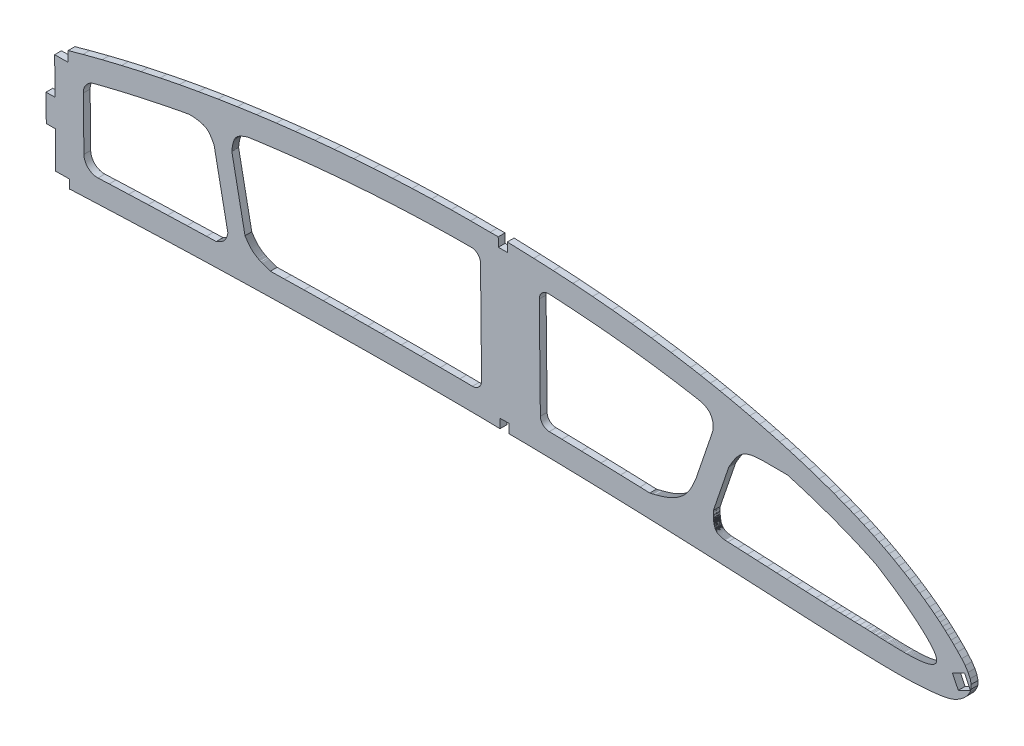
from build123d import *

# Parameters (mm, degrees)
EXTRUDE_1_DEPTH = 1.5


with BuildPart() as part:
    # Model → 凸台-拉伸1 (new body)
    with BuildSketch(Plane.XY):
        Polygon((245.061758411, 242.561421098), (248.356863221, 243.468516155), (252.62401464, 244.576706018), (256.908564126, 245.622748417), (261.208623156, 246.60453777), (265.451896207, 247.507128937), (269.706467636, 248.349244104), (273.972283179, 249.131881797), (278.247237251, 249.85693054), (282.53221985, 250.526441649), (286.826178185, 251.141359387), (291.127950932, 251.704625068), (295.409579349, 252.214719273), (299.695972335, 252.673997153), (303.986185628, 253.081405916), (308.281109225, 253.438996881), (312.579907394, 253.743720202), (316.882580135, 253.995575881), (321.189073183, 254.195562443), (325.504541967, 254.340955634), (329.818946954, 254.43221133), (334.135446521, 254.466496746), (338.449992296, 254.44459335), (340.237576624, 254.455253094), (340.258893117, 252.455366696), (342.258779515, 252.476683188), (342.237463023, 254.476569587), (348.083064962, 254.265730174), (352.397338908, 254.064547871), (356.760182306, 253.798906214), (361.117620455, 253.466873419), (365.467764832, 253.066343902), (369.809833972, 252.593269291), (374.142992142, 252.044599743), (378.465405085, 251.417231147), (382.776237068, 250.708113659), (384.972874726, 250.313733135), (387.164715055, 249.897059436), (389.351758055, 249.458092562), (391.534057991, 248.995833987), (393.711614863, 248.510283711), (395.883430144, 248.001387469), (398.050502361, 247.469199526), (400.269834302, 246.896788191), (402.481590394, 246.29792678), (404.684934905, 245.669565448), (406.87886931, 245.011649931), (409.063556403, 244.321184649), (411.237107661, 243.596064017), (413.400575875, 242.835343776), (414.518468497, 242.425402212), (415.631856871, 242.006202583), (416.739905265, 241.574695045), (417.843557942, 241.131932391), (418.94187064, 240.676861827), (420.033844832, 240.209429089), (421.118536256, 239.728581386), (422.24944198, 239.208183227), (423.372120675, 238.673317311), (424.487679398, 238.122040851), (425.596172413, 237.553355318), (426.697599721, 236.967260714), (427.79401264, 236.362867041), (428.884466908, 235.739121508), (430.055877598, 235.044664889), (431.21744406, 234.328642296), (432.364065133, 233.592779459), (433.491583915, 232.839854896), (434.596006299, 232.069651548), (435.673229649, 231.283949408), (436.719097064, 230.485526995), (437.345030674, 229.987759864), (437.962411664, 229.481516135), (438.575559732, 228.961021709), (439.188577513, 228.424496593), (439.807836022, 227.865276692), (440.435495108, 227.280474954), (441.078870046, 226.664480076), (441.942777561, 225.805093781), (442.786269421, 224.897528642), (443.556608269, 223.953940777), (444.199168225, 222.98438072), (444.663208985, 222.00111312), (444.893051878, 221.015132773), (444.835959546, 220.038595797), (444.636263474, 219.437874165), (444.321433013, 218.85493096), (443.908008994, 218.298676899), (443.415582094, 217.777186968), (442.859694618, 217.29931762), (442.258830185, 216.875086629), (441.630582419, 216.512460452), (441.062137969, 216.247222998), (440.4860419, 216.030642021), (439.904616856, 215.856834891), (439.318351222, 215.71681487), (438.727570588, 215.604590798), (438.133653336, 215.513227253), (437.537033585, 215.434736024), (436.470086064, 215.312658231), (435.40016472, 215.208445386), (434.326216761, 215.123041751), (433.250402035, 215.053560277), (432.172720542, 215.000000962), (431.094279339, 214.960421019), (430.015078426, 214.934820448), (428.934227806, 214.921147931), (427.854723059, 214.919566263), (426.775782719, 214.926027072), (425.69735252, 214.941528886), (424.618650996, 214.962023332), (423.540676674, 214.987564677), (422.46154103, 215.016047336), (421.381352594, 215.045474256), (420.301055629, 215.07689823), (419.220650133, 215.110319256), (418.140190372, 215.14473881), (417.059622082, 215.181155416), (415.979943788, 215.219623341), (414.899158437, 215.260034054), (412.735265092, 215.346738109), (410.572988946, 215.440540379), (408.410387209, 215.54033381), (406.248512674, 215.645174138), (404.086529609, 215.752011519), (401.92543654, 215.860900219), (399.762292154, 215.970678915), (397.599256297, 216.078460557), (395.437273232, 216.185297939), (393.275398697, 216.290138267), (391.113578426, 216.393980069), (388.950922425, 216.494772025), (386.788374953, 216.593566929), (384.62499175, 216.689311988), (380.303652097, 216.873085219), (375.983017888, 217.043877604), (371.661982069, 217.203631932), (367.341651694, 217.350405414), (363.020029712, 217.484089521), (358.697170386, 217.603685726), (354.373019453, 217.710192556), (350.055673654, 217.802047077), (346.130614818, 217.872924456), (343.627304004, 217.891903444), (342.627332743, 217.89948478), (342.60601625, 219.899371179), (340.606129852, 219.878054686), (340.627446344, 217.878168288), (336.105775831, 217.952615996), (331.790470346, 217.988498765), (327.472928991, 218.010239366), (323.155148821, 218.01794633), (318.842122466, 218.011890983), (314.530854349, 217.991910528), (310.220237411, 217.959947755), (305.909327393, 217.914949871), (301.599068554, 217.857969669), (297.287409577, 217.789897144), (292.975348989, 217.710786562), (288.665882369, 217.620800717), (284.357956926, 217.520883872), (280.05157266, 217.411036027), (275.744732517, 217.29114865), (271.438435024, 217.161276008), (267.131681654, 217.021363836), (262.824363879, 216.873409185), (258.51858728, 216.715523534), (254.214243327, 216.549703936), (249.91027923, 216.376894651), (245.607639249, 216.198148472), (245.343913568, 216.089980575), (245.322597075, 218.089866974), (242.322767478, 218.057892235), (242.236331184, 226.16723612), (240.236444786, 226.145919628), (240.172495309, 232.145578824), (242.172381707, 232.166895316), (242.085943331, 240.276434662), (245.085772928, 240.308409401), align=None)
        Polygon((421.863845901, 220.03047663), (421.328061363, 220.045190252), (420.247764398, 220.076614226), (419.167358902, 220.110035253), (418.086899141, 220.144454806), (417.006330851, 220.180871413), (415.926652557, 220.219339337), (414.845867206, 220.25975005), (413.763920534, 220.303102077), (412.300139976, 220.363018541), (410.519697715, 220.440256376), (408.357095978, 220.540049806), (406.195221443, 220.644890134), (404.033238378, 220.751727516), (401.872145309, 220.860616215), (399.709000923, 220.970394911), (397.545965066, 221.078176554), (395.383982001, 221.185013935), (393.222107466, 221.289854263), (391.060287195, 221.393696065), (390.382081169, 221.425304288), (390.347132409, 221.430643269), (390.317070163, 221.43632318), (390.287007918, 221.442003092), (390.24694624, 221.447576422), (390.216883995, 221.453256333), (390.186811091, 221.459936188), (390.156748846, 221.4656161), (390.1266866, 221.471296012), (390.086624923, 221.476869341), (390.056552019, 221.483549196), (390.026489774, 221.489229108), (389.996427528, 221.49490902), (389.956355192, 221.501482293), (389.926282289, 221.508162148), (389.896220043, 221.513842059), (389.86614714, 221.520521914), (389.836074236, 221.527201769), (389.806001332, 221.533881624), (389.765928996, 221.540454897), (389.735845434, 221.548134695), (389.705772531, 221.55481455), (389.675688969, 221.562494348), (389.645616065, 221.569174203), (389.615532503, 221.576854002), (389.585448941, 221.5845338), (389.555354721, 221.593213541), (389.525271159, 221.600893339), (389.495176939, 221.609573081), (389.465093377, 221.617252879), (389.434999157, 221.62593262), (389.404894278, 221.635612305), (389.374800058, 221.644292047), (389.34469518, 221.653971731), (389.314590301, 221.663651416), (389.284485423, 221.6733311), (389.254380544, 221.683010785), (389.224275666, 221.69269047), (389.204159561, 221.70347668), (389.174044025, 221.714156308), (389.14391783, 221.725835879), (389.113802293, 221.736515506), (389.09367553, 221.74830166), (389.063549335, 221.759981231), (389.033412482, 221.772660745), (389.013275061, 221.785446842), (388.983138207, 221.798126356), (388.953001354, 221.81080587), (388.932853275, 221.82459191), (388.902705763, 221.838271367), (388.882557684, 221.852057407), (388.852399514, 221.866736808), (388.832240777, 221.881522791), (388.802071949, 221.897202135), (388.781913211, 221.911988118), (388.761733157, 221.928773987), (388.731564329, 221.944453331), (388.711384275, 221.961239201), (388.691204221, 221.97802507), (388.671013508, 221.995810883), (388.650822796, 222.013596695), (388.620621993, 222.032275869), (388.600420623, 222.051061625), (388.580219252, 222.069847381), (388.560007223, 222.08963308), (388.539795194, 222.109418779), (388.519572507, 222.130204421), (388.509349252, 222.151096646), (388.489126565, 222.171882288), (388.468893219, 222.193667873), (388.448659874, 222.215453459), (388.42841587, 222.238238987), (388.418171298, 222.261131099), (388.397927295, 222.283916627), (388.377672633, 222.307702099), (388.367417403, 222.331594153), (388.347152083, 222.356379568), (388.336896853, 222.380271623), (388.316631533, 222.405057038), (388.306354986, 222.430948979), (388.286079008, 222.456734337), (388.275802462, 222.482626278), (388.255526483, 222.508411636), (388.245239279, 222.53530352), (388.234952074, 222.562195404), (388.214665437, 222.588980705), (388.204378233, 222.615872589), (388.19408037, 222.643764416), (388.183782507, 222.671656243), (388.173484644, 222.69954807), (388.163176123, 222.728439841), (388.14286817, 222.757225029), (388.132570307, 222.785116856), (388.122251128, 222.815008569), (388.111942606, 222.843900339), (388.101623427, 222.873792053), (388.091314906, 222.902683823), (388.080995726, 222.932575537), (388.080675979, 222.962573833), (388.070346141, 222.99346549), (388.060026962, 223.023357203), (388.049697124, 223.05424886), (388.039377945, 223.084140573), (388.029048107, 223.11503223), (388.028717702, 223.146030469), (388.018377206, 223.177922069), (388.008047368, 223.208813726), (387.997717531, 223.239705383), (387.997376467, 223.271703565), (387.987046629, 223.302595222), (387.976706133, 223.334486822), (387.976365069, 223.366485004), (387.966035232, 223.397376661), (387.965694168, 223.429374843), (387.955353672, 223.461266443), (387.955012608, 223.493264625), (387.944672112, 223.525156225), (387.944331048, 223.557154408), (387.933990553, 223.589046008), (387.933649489, 223.62104419), (387.923308993, 223.65293579), (387.922957271, 223.685933915), (387.912616775, 223.717825515), (387.912275711, 223.749823698), (387.911934647, 223.78182188), (387.901594151, 223.81371348), (387.901253087, 223.845711662), (387.890912591, 223.877603262), (387.890571528, 223.909601445), (387.890241122, 223.940599684), (387.889900058, 223.972597866), (387.879559562, 224.004489466), (387.879229157, 224.035487705), (387.878888093, 224.067485888), (387.868547597, 224.099377488), (387.868217191, 224.130375727), (387.867886786, 224.161373966), (387.867545722, 224.193372148), (387.867215316, 224.224370387), (387.856885478, 224.255262044), (387.856555073, 224.286260283), (387.856224667, 224.317258523), (387.855894262, 224.348256762), (387.855563856, 224.379255001), (387.85523345, 224.41025324), (387.844903613, 224.441144897), (387.844573207, 224.472143136), (387.84425346, 224.502141432), (387.843923054, 224.533139671), (387.843603307, 224.563137967), (387.843272901, 224.594136206), (387.842942495, 224.625134445), (387.842622748, 224.655132741), (387.842303001, 224.685131037), (387.841972595, 224.716129277), (387.841652848, 224.746127573), (387.8413331, 224.776125869), (387.841002695, 224.807124108), (387.840682947, 224.837122404), (387.830363768, 224.867014117), (387.83004402, 224.897012413), (387.829724273, 224.927010709), (387.829404526, 224.957009005), (387.829084778, 224.987007301), (387.838764463, 225.01711218), (387.838444715, 225.047110476), (387.838124968, 225.077108772), (387.837805221, 225.107107068), (387.837485473, 225.137105363), (387.837165726, 225.167103659), (387.836845979, 225.197101955), (387.836526231, 225.227100251), (387.836217142, 225.256098604), (387.835897395, 225.2860969), (387.835577647, 225.316095196), (387.835268558, 225.345093549), (387.834948811, 225.375091845), (387.834629063, 225.405090141), (387.834309316, 225.435088437), (387.834000227, 225.46408679), (387.833680479, 225.494085086), (387.83337139, 225.523083438), (387.843051075, 225.553188317), (387.842731327, 225.583186613), (387.842422238, 225.612184966), (387.842102491, 225.642183262), (387.841793402, 225.671181614), (387.841473654, 225.70117991), (387.841164565, 225.730178263), (387.840844818, 225.760176559), (387.840525071, 225.790174855), (387.840215981, 225.819173208), (391.243892453, 235.813018087), (391.283112129, 235.886440271), (391.322321147, 235.960862397), (391.371529597, 236.035391106), (391.410738615, 236.109813233), (391.449958291, 236.183235416), (391.489167308, 236.257657543), (391.538386416, 236.331186309), (391.577606092, 236.404608492), (391.61681511, 236.479030619), (391.666034218, 236.552559385), (391.705253894, 236.625981568), (391.744484228, 236.698403808), (391.793703336, 236.771932574), (391.832933671, 236.844354814), (391.872164005, 236.916777054), (391.921393771, 236.989305877), (391.960634764, 237.060728174), (391.999865098, 237.133150414), (392.049105522, 237.204679294), (392.088357173, 237.275101648), (392.137597598, 237.346630527), (392.176849248, 237.417052881), (392.226110989, 237.486581874), (392.26536264, 237.557004228), (392.314624381, 237.626533221), (392.353897348, 237.694955688), (392.403169748, 237.763484738), (392.452442147, 237.832013788), (392.491725772, 237.899436312), (392.54100883, 237.966965419), (392.590302545, 238.033494582), (392.629607487, 238.09891722), (392.678901203, 238.165446383), (392.728216235, 238.22997566), (392.777531267, 238.294504938), (392.8268463, 238.359034215), (392.87617199, 238.422563548), (392.915508907, 238.484986357), (392.964845256, 238.547515747), (393.014192262, 238.609045195), (393.07354936, 238.669681282), (393.122907025, 238.730210786), (393.172275348, 238.789740347), (393.221643672, 238.849269908), (393.271033312, 238.906799583), (393.320422952, 238.964329257), (393.379822682, 239.020965571), (393.42922298, 239.077495303), (393.478644595, 239.132025148), (393.538065641, 239.186661575), (393.587497914, 239.240191477), (393.646940277, 239.292828018), (393.706382641, 239.345464559), (393.755846888, 239.395994632), (393.815310568, 239.446631286), (393.874784906, 239.496267998), (393.93428056, 239.543904823), (393.983776782, 239.591435066), (394.043283095, 239.638071948), (394.102800066, 239.683708886), (394.162327695, 239.728345882), (394.231865414, 239.772089517), (394.29141436, 239.814726626), (394.350973964, 239.856363792), (394.410544226, 239.897001015), (394.480124578, 239.936744877), (394.539716157, 239.975382213), (394.599329052, 240.012019663), (394.668941379, 240.048763695), (394.738575023, 240.083507841), (394.798209234, 240.118145405), (394.867864194, 240.150889664), (394.937519155, 240.183633924), (395.007195431, 240.214378297), (395.076882366, 240.244122727), (395.146579959, 240.272867214), (395.21628821, 240.300611758), (395.285996462, 240.328356301), (395.355726029, 240.354100959), (395.425466255, 240.378845673), (395.505205913, 240.403696969), (395.574967456, 240.426441797), (395.644728998, 240.449186624), (395.724500631, 240.471038091), (395.79428349, 240.491783032), (395.87407644, 240.511634613), (395.943880615, 240.530379668), (396.023684223, 240.549231305), (396.093499056, 240.566976417), (396.173334639, 240.582828224), (396.253159563, 240.599679975), (396.333005803, 240.61453184), (396.402852612, 240.629277122), (396.48270951, 240.643129043), (396.562577067, 240.655981021), (396.642444624, 240.668832999), (396.72232284, 240.680685034), (396.802201055, 240.692537069), (396.882089928, 240.703389161), (396.96198946, 240.713241309), (397.041888992, 240.723093458), (397.121799182, 240.731945663), (397.20172003, 240.739797925), (397.28163022, 240.74865013), (397.361561726, 240.755502449), (397.441493233, 240.762354768), (397.531424171, 240.769313669), (397.611366336, 240.775166045), (397.691308501, 240.781018421), (397.771261324, 240.785870853), (397.851214147, 240.790723286), (397.94117706, 240.794682358), (398.021129883, 240.79953479), (398.101104022, 240.802387336), (398.181067503, 240.806239825), (398.271041075, 240.809198954), (398.351015214, 240.8120515), (398.431000012, 240.813904103), (398.520973583, 240.816863232), (398.600958381, 240.818715834), (398.680953837, 240.819568494), (398.760938635, 240.821421097), (398.850933523, 240.822380339), (398.93091832, 240.824232942), (399.010913776, 240.825085602), (399.100908664, 240.826044844), (399.180914778, 240.82589756), (399.260910234, 240.82675022), (399.34090569, 240.82760288), (399.430911237, 240.827562179), (399.510917351, 240.827414895), (399.590912807, 240.828267555), (399.670918921, 240.828120271), (399.750914377, 240.828972931), (399.840919923, 240.82893223), (399.920926037, 240.828784947), (400.000932151, 240.828637663), (400.080927607, 240.829490323), (400.160933722, 240.829343039), (400.240939836, 240.829195756), (400.32094595, 240.829048472), (400.400952064, 240.828901189), (400.480958178, 240.828753905), (400.560964292, 240.828606622), (400.640970407, 240.828459338), (400.730975953, 240.828418637), (400.810982067, 240.828271354), (400.890988181, 240.82812407), (400.970994295, 240.827976787), (401.041000978, 240.827722921), (401.121007092, 240.827575637), (401.201013206, 240.827428354), (401.28101932, 240.82728107), (401.361025434, 240.827133787), (401.441031549, 240.826986503), (401.521037663, 240.82683922), (401.601054435, 240.825691993), (401.681060549, 240.82554471), (401.761066664, 240.825397426), (401.841072778, 240.825250143), (401.921078892, 240.825102859), (401.991096232, 240.82384905), (402.071102347, 240.823701766), (402.151108461, 240.823554483), (402.231125233, 240.822407256), (402.311131347, 240.822259973), (402.391137462, 240.822112689), (402.461144144, 240.821858823), (402.541160916, 240.820711596), (402.62116703, 240.820564313), (402.701183803, 240.819417086), (402.781189917, 240.819269803), (402.851196599, 240.819015937), (402.931213372, 240.81786871), (403.011219486, 240.817721427), (403.0912256, 240.817574143), (403.171242372, 240.816426916), (403.241249055, 240.81617305), (403.321265827, 240.815025824), (403.401271941, 240.81487854), (403.481288714, 240.813731314), (403.551295396, 240.813477448), (403.63130151, 240.813330164), (403.711318282, 240.812182937), (403.791324397, 240.812035654), (403.871341169, 240.810888427), (403.941347851, 240.810634561), (404.021364624, 240.809487334), (404.101370738, 240.809340051), (404.18138751, 240.808192824), (404.254133518, 240.807905521), (404.738226136, 240.669849452), (406.932160541, 240.011933935), (409.116847634, 239.321468652), (411.290398892, 238.596348021), (413.453867106, 237.83562778), (414.571759728, 237.425686215), (415.685148102, 237.006486587), (416.793196496, 236.574979049), (417.896849173, 236.132216394), (418.995161871, 235.67714583), (420.087136063, 235.209713093), (421.171827487, 234.728865389), (422.302733211, 234.208467231), (423.425411906, 233.673601315), (423.981493894, 233.397806318), (424.12241321, 233.312303414), (424.253333093, 233.226693927), (424.384252976, 233.141084441), (424.52518295, 233.054581594), (424.656102833, 232.968972108), (424.787022717, 232.883362621), (424.92795269, 232.796859774), (425.058883232, 232.710250345), (425.199813205, 232.623747498), (425.330743747, 232.537138068), (425.461674288, 232.450528639), (425.60261492, 232.363025848), (425.73355612, 232.275416476), (425.874496752, 232.187913685), (426.00544861, 232.099304369), (426.1463999, 232.010801636), (426.277351758, 231.92219232), (426.418303048, 231.833689586), (426.549276223, 231.743080384), (426.690238171, 231.653577707), (426.821211346, 231.562968505), (426.96219461, 231.471465942), (427.103177875, 231.379963379), (427.234161708, 231.288354233), (427.375155631, 231.195851727), (427.516160212, 231.102349278), (427.647165362, 231.008740246), (427.788180601, 230.914237853), (427.929206499, 230.818735517), (428.070232397, 230.723233181), (428.211268953, 230.626730902), (428.352305509, 230.530228623), (428.493363381, 230.431726458), (428.624421822, 230.33311771), (428.765490353, 230.233615601), (428.916568974, 230.133220132), (429.057648163, 230.03271808), (429.198748668, 229.930216142), (429.339849174, 229.827714203), (429.480960337, 229.724212322), (429.622082159, 229.619710497), (429.77322473, 229.513315369), (429.914367868, 229.406813658), (430.055521665, 229.299312003), (430.206685552, 229.190916988), (430.347860665, 229.081415448), (430.499045869, 228.971020546), (430.640252957, 228.858519176), (430.791459477, 228.746124388), (430.942687313, 228.631729714), (431.09391515, 228.51733504), (431.23516487, 228.400833897), (431.38643534, 228.28243945), (431.537705809, 228.164045003), (431.688997595, 228.04365067), (431.840289381, 227.923256336), (431.991613142, 227.799862173), (432.142936903, 227.67646801), (432.304281412, 227.551180543), (432.455637147, 227.424786551), (432.607014199, 227.296392672), (432.768390683, 227.168105375), (432.919789051, 227.03771161), (433.071198078, 226.906317901), (433.232606537, 226.775030775), (433.38403688, 226.64163718), (433.535467223, 226.508243585), (433.686908224, 226.373850047), (433.838349226, 226.239456509), (433.989790227, 226.105062971), (434.141241887, 225.969669489), (434.292693546, 225.834276008), (434.434145774, 225.698775944), (434.585608092, 225.56238252), (434.727060319, 225.426882456), (434.868512547, 225.291382392), (435.009964775, 225.155882328), (435.141406912, 225.021275625), (435.272849049, 224.886668922), (435.404291187, 224.752062219), (435.535712008, 224.619455402), (435.657144055, 224.48574206), (435.778554785, 224.354028604), (435.899954858, 224.223315091), (436.011355498, 224.092494996), (436.122734822, 223.963674787), (436.224104056, 223.835747939), (436.325462631, 223.708821034), (436.42679989, 223.583894016), (436.518127059, 223.459860358), (436.609443569, 223.336826643), (436.690728673, 223.216686176), (436.772003119, 223.097545652), (436.843256816, 222.980298431), (436.914489196, 222.865051097), (436.975700828, 222.751697067), (437.026891712, 222.640236341), (437.078061279, 222.530775502), (437.129209529, 222.423314549), (437.160316283, 222.319640203), (437.191412378, 222.216965801), (437.222476499, 222.117291229), (437.243509213, 222.020509903), (437.254521178, 221.925621882), (437.255501737, 221.833627107), (437.256460979, 221.743632219), (437.247388814, 221.656530579), (437.238295333, 221.571428824), (437.219170445, 221.489220317), (437.190024809, 221.408905114), (437.160847198, 221.33158974), (437.121659497, 221.255167727), (437.082429163, 221.182745487), (437.033188738, 221.111216607), (436.983926997, 221.041687614), (436.914634417, 220.974945286), (436.855319953, 220.910309426), (436.785984741, 220.847566871), (436.706618121, 220.787717562), (436.627240843, 220.728868197), (436.537842817, 220.671912136), (436.448412816, 220.617955904), (436.348972725, 220.564893033), (436.249500659, 220.514829992), (436.140018503, 220.465660311), (436.030504373, 220.41949046), (435.910980151, 220.37421397), (435.791434614, 220.330937366), (435.661868328, 220.289554066), (435.532280725, 220.250170652), (435.402682464, 220.211787182), (435.263063455, 220.175297015), (435.113423697, 220.140700153), (434.973762055, 220.108209759), (434.814080232, 220.077506087), (434.664397842, 220.046908997), (434.504684044, 220.019205155), (434.334960156, 219.992394673), (434.165214952, 219.967584077), (433.99545909, 219.943773425), (433.815682479, 219.921856077), (433.63589521, 219.900938672), (433.456086624, 219.882021153), (433.266267948, 219.863996995), (433.076438614, 219.84697278), (432.886587963, 219.831948452), (432.686727222, 219.817817484), (432.486855823, 219.80468646), (432.286973766, 219.792555379), (432.07707096, 219.782317601), (431.867157496, 219.773079767), (431.657233373, 219.764841876), (431.447287935, 219.758603872), (431.227343064, 219.752259285), (431.007387535, 219.746914641), (430.777411257, 219.743463301), (430.557434411, 219.740118544), (430.327436817, 219.738667091), (430.097439223, 219.737215637), (429.867420313, 219.73776407), (429.62740197, 219.738205921), (429.387372969, 219.739647714), (429.14733331, 219.742089451), (428.907282993, 219.745531131), (428.667222017, 219.749972755), (428.41716161, 219.754307796), (428.167090544, 219.75964278), (427.927008252, 219.766084289), (427.666916438, 219.773312577), (427.416824055, 219.780647448), (427.166721015, 219.788982261), (426.906618542, 219.797210493), (426.656504844, 219.806545249), (426.396391713, 219.815773424), (426.136267924, 219.826001541), (425.876144135, 219.836229659), (425.606010256, 219.847351137), (425.345875808, 219.858579198), (425.085730703, 219.870807202), (424.815586165, 219.882928624), (424.55544106, 219.895156627), (424.285285864, 219.908277992), (424.015130668, 219.921399357), (423.754974905, 219.934627304), (423.484819709, 219.947748669), (423.214664513, 219.960870034), (422.944498659, 219.974991341), (422.674343463, 219.988112706), (422.404177609, 220.002234014), (422.134011755, 220.016355322), align=None, mode=Mode.SUBTRACT)
        with BuildLine():
            Line((373.769208748, 222.123470764), (371.608690838, 222.203347928))
            Line((371.608690838, 222.203347928), (367.288360463, 222.350121411))
            Line((367.288360463, 222.350121411), (362.966738481, 222.483805518))
            Line((362.966738481, 222.483805518), (358.643879155, 222.603401723))
            Line((358.643879155, 222.603401723), (354.319728222, 222.709908552))
            Line((354.319728222, 222.709908552), (351.514879839, 222.769583644))
            ThreePointArc((351.514879839, 222.769583644), (350.135722728, 223.362442716), (349.557535198, 224.74781465))
            Line((349.557535198, 224.74781465), (349.319349447, 247.094100977))
            ThreePointArc((349.319349447, 247.094100977), (349.930662366, 248.554814458), (351.412398182, 249.113246486))
            Line((351.412398182, 249.113246486), (352.450630139, 249.064831875))
            Line((352.450630139, 249.064831875), (356.813473537, 248.799190218))
            Line((356.813473537, 248.799190218), (361.170911686, 248.467157422))
            Line((361.170911686, 248.467157422), (365.521056063, 248.066627905))
            Line((365.521056063, 248.066627905), (369.863125203, 247.593553295))
            Line((369.863125203, 247.593553295), (373.695610703, 247.108279505))
            Line((373.695610703, 247.108279505), (374.196283373, 247.044883746))
            Line((374.196283373, 247.044883746), (378.518696315, 246.417515151))
            Line((378.518696315, 246.417515151), (382.829528299, 245.708397663))
            Line((382.829528299, 245.708397663), (385.022272633, 245.314246208))
            Line((385.022272633, 245.314246208), (385.052388169, 245.30356658))
            Line((385.052388169, 245.30356658), (385.082493048, 245.293886896))
            Line((385.082493048, 245.293886896), (385.112597926, 245.284207211))
            Line((385.112597926, 245.284207211), (385.142713463, 245.273527583))
            Line((385.142713463, 245.273527583), (385.172818341, 245.263847899))
            Line((385.172818341, 245.263847899), (385.20292322, 245.254168214))
            Line((385.20292322, 245.254168214), (385.233038756, 245.243488586))
            Line((385.233038756, 245.243488586), (385.263143635, 245.233808902))
            Line((385.263143635, 245.233808902), (385.293259171, 245.223129274))
            Line((385.293259171, 245.223129274), (385.32336405, 245.213449589))
            Line((385.32336405, 245.213449589), (385.343480155, 245.202663379))
            Line((385.343480155, 245.202663379), (385.373595691, 245.191983751))
            Line((385.373595691, 245.191983751), (385.40370057, 245.182304067))
            Line((385.40370057, 245.182304067), (385.433816106, 245.171624439))
            Line((385.433816106, 245.171624439), (385.463931643, 245.160944811))
            Line((385.463931643, 245.160944811), (385.49404718, 245.150265183))
            Line((385.49404718, 245.150265183), (385.524162716, 245.139585555))
            Line((385.524162716, 245.139585555), (385.554278253, 245.128905927))
            Line((385.554278253, 245.128905927), (385.574394358, 245.118119717))
            Line((385.574394358, 245.118119717), (385.604509895, 245.107440089))
            Line((385.604509895, 245.107440089), (385.634636089, 245.095760518))
            Line((385.634636089, 245.095760518), (385.664751626, 245.085080891))
            Line((385.664751626, 245.085080891), (385.694877821, 245.07340132))
            Line((385.694877821, 245.07340132), (385.725004016, 245.061721749))
            Line((385.725004016, 245.061721749), (385.745120121, 245.050935538))
            Line((385.745120121, 245.050935538), (385.775246316, 245.039255967))
            Line((385.775246316, 245.039255967), (385.805372511, 245.027576396))
            Line((385.805372511, 245.027576396), (385.835509364, 245.014896882))
            Line((385.835509364, 245.014896882), (385.865635559, 245.003217311))
            Line((385.865635559, 245.003217311), (385.885762322, 244.991431158))
            Line((385.885762322, 244.991431158), (385.915899175, 244.978751643))
            Line((385.915899175, 244.978751643), (385.946036028, 244.966072129))
            Line((385.946036028, 244.966072129), (385.976172881, 244.953392615))
            Line((385.976172881, 244.953392615), (385.996310302, 244.940606518))
            Line((385.996310302, 244.940606518), (386.026447156, 244.927927004))
            Line((386.026447156, 244.927927004), (386.056594667, 244.914247547))
            Line((386.056594667, 244.914247547), (386.076732088, 244.90146145))
            Line((386.076732088, 244.90146145), (386.1068796, 244.887781993))
            Line((386.1068796, 244.887781993), (386.137027111, 244.874102535))
            Line((386.137027111, 244.874102535), (386.15717519, 244.860316495))
            Line((386.15717519, 244.860316495), (386.18733336, 244.845637095))
            Line((386.18733336, 244.845637095), (386.217480872, 244.831957637))
            Line((386.217480872, 244.831957637), (386.237639609, 244.817171654))
            Line((386.237639609, 244.817171654), (386.267797779, 244.802492254))
            Line((386.267797779, 244.802492254), (386.287956517, 244.787706271))
            Line((386.287956517, 244.787706271), (386.318125344, 244.772026927))
            Line((386.318125344, 244.772026927), (386.348283514, 244.757347526))
            Line((386.348283514, 244.757347526), (386.36845291, 244.7415616))
            Line((386.36845291, 244.7415616), (386.398621738, 244.725882256))
            Line((386.398621738, 244.725882256), (386.418801792, 244.709096387))
            Line((386.418801792, 244.709096387), (386.44897062, 244.693417043))
            Line((386.44897062, 244.693417043), (386.469150674, 244.676631173))
            Line((386.469150674, 244.676631173), (386.489330728, 244.659845304))
            Line((386.489330728, 244.659845304), (386.519520873, 244.642166074))
            Line((386.519520873, 244.642166074), (386.539711585, 244.624380261))
            Line((386.539711585, 244.624380261), (386.56990173, 244.606701031))
            Line((386.56990173, 244.606701031), (386.590092442, 244.588915218))
            Line((386.590092442, 244.588915218), (386.610283154, 244.571129406))
            Line((386.610283154, 244.571129406), (386.640483957, 244.552450232))
            Line((386.640483957, 244.552450232), (386.660685328, 244.533664476))
            Line((386.660685328, 244.533664476), (386.680897357, 244.513878777))
            Line((386.680897357, 244.513878777), (386.711098159, 244.495199604))
            Line((386.711098159, 244.495199604), (386.731310188, 244.475413905))
            Line((386.731310188, 244.475413905), (386.751522217, 244.455628206))
            Line((386.751522217, 244.455628206), (386.771744904, 244.434842563))
            Line((386.771744904, 244.434842563), (386.791967592, 244.414056921))
            Line((386.791967592, 244.414056921), (386.822189711, 244.393377861))
            Line((386.822189711, 244.393377861), (386.842412398, 244.372592219))
            Line((386.842412398, 244.372592219), (386.862645743, 244.350806634))
            Line((386.862645743, 244.350806634), (386.882879089, 244.329021048))
            Line((386.882879089, 244.329021048), (386.903112434, 244.307235463))
            Line((386.903112434, 244.307235463), (386.923345779, 244.285449877))
            Line((386.923345779, 244.285449877), (386.943589783, 244.262664349))
            Line((386.943589783, 244.262664349), (386.963833787, 244.23987882))
            Line((386.963833787, 244.23987882), (386.98407779, 244.217093291))
            Line((386.98407779, 244.217093291), (387.004332452, 244.193307819))
            Line((387.004332452, 244.193307819), (387.024576456, 244.170522291))
            Line((387.024576456, 244.170522291), (387.044831118, 244.146736819))
            Line((387.044831118, 244.146736819), (387.06508578, 244.122951347))
            Line((387.06508578, 244.122951347), (387.0853511, 244.098165932))
            Line((387.0853511, 244.098165932), (387.105605762, 244.07438046))
            Line((387.105605762, 244.07438046), (387.11587165, 244.049488463))
            Line((387.11587165, 244.049488463), (387.13613697, 244.024703048))
            Line((387.13613697, 244.024703048), (387.15640229, 243.999917633))
            Line((387.15640229, 243.999917633), (387.17666761, 243.975132217))
            Line((387.17666761, 243.975132217), (387.186944157, 243.949240277))
            Line((387.186944157, 243.949240277), (387.207220135, 243.923454919))
            Line((387.207220135, 243.923454919), (387.227496113, 243.89766956))
            Line((387.227496113, 243.89766956), (387.23777266, 243.87177762))
            Line((387.23777266, 243.87177762), (387.258048638, 243.845992261))
            Line((387.258048638, 243.845992261), (387.278335275, 243.81920696))
            Line((387.278335275, 243.81920696), (387.288611821, 243.793315019))
            Line((387.288611821, 243.793315019), (387.308898458, 243.766529718))
            Line((387.308898458, 243.766529718), (387.319185663, 243.739637834))
            Line((387.319185663, 243.739637834), (387.339482957, 243.711852589))
            Line((387.339482957, 243.711852589), (387.349770162, 243.684960705))
            Line((387.349770162, 243.684960705), (387.370056799, 243.658175404))
            Line((387.370056799, 243.658175404), (387.380354662, 243.630283577))
            Line((387.380354662, 243.630283577), (387.400651956, 243.602498332))
            Line((387.400651956, 243.602498332), (387.410949819, 243.574606505))
            Line((387.410949819, 243.574606505), (387.431247114, 243.54682126))
            Line((387.431247114, 243.54682126), (387.441544977, 243.518929433))
            Line((387.441544977, 243.518929433), (387.451853498, 243.490037663))
            Line((387.451853498, 243.490037663), (387.472150793, 243.462252418))
            Line((387.472150793, 243.462252418), (387.482459314, 243.433360648))
            Line((387.482459314, 243.433360648), (387.492757177, 243.405468821))
            Line((387.492757177, 243.405468821), (387.503065698, 243.37657705))
            Line((387.503065698, 243.37657705), (387.513374219, 243.34768528))
            Line((387.513374219, 243.34768528), (387.533682173, 243.318900092))
            Line((387.533682173, 243.318900092), (387.544001352, 243.289008379))
            Line((387.544001352, 243.289008379), (387.554309873, 243.260116608))
            Line((387.554309873, 243.260116608), (387.564618394, 243.231224838))
            Line((387.564618394, 243.231224838), (387.574937574, 243.201333124))
            Line((387.574937574, 243.201333124), (387.585246095, 243.172441354))
            Line((387.585246095, 243.172441354), (387.595565274, 243.142549641))
            Line((387.595565274, 243.142549641), (387.605884453, 243.112657927))
            Line((387.605884453, 243.112657927), (387.616192975, 243.083766157))
            Line((387.616192975, 243.083766157), (387.626512154, 243.053874443))
            Line((387.626512154, 243.053874443), (387.636831333, 243.02398273))
            Line((387.636831333, 243.02398273), (387.647150513, 242.994091016))
            Line((387.647150513, 242.994091016), (387.657469692, 242.964199303))
            Line((387.657469692, 242.964199303), (387.657789439, 242.934201007))
            Line((387.657789439, 242.934201007), (387.668119277, 242.90330935))
            Line((387.668119277, 242.90330935), (387.678438456, 242.873417637))
            Line((387.678438456, 242.873417637), (387.688757636, 242.843525923))
            Line((387.688757636, 242.843525923), (387.689077383, 242.813527627))
            Line((387.689077383, 242.813527627), (387.699407221, 242.78263597))
            Line((387.699407221, 242.78263597), (387.7097264, 242.752744257))
            Line((387.7097264, 242.752744257), (387.710056806, 242.721746018))
            Line((387.710056806, 242.721746018), (387.720375985, 242.691854304))
            Line((387.720375985, 242.691854304), (387.720695733, 242.661856008))
            Line((387.720695733, 242.661856008), (387.73102557, 242.630964351))
            Line((387.73102557, 242.630964351), (387.74134475, 242.601072638))
            Line((387.74134475, 242.601072638), (387.741675155, 242.570074399))
            Line((387.741675155, 242.570074399), (387.741994903, 242.540076103))
            Line((387.741994903, 242.540076103), (387.75232474, 242.509184446))
            Line((387.75232474, 242.509184446), (387.752644488, 242.47918615))
            Line((387.752644488, 242.47918615), (387.762974325, 242.448294493))
            Line((387.762974325, 242.448294493), (387.763294073, 242.418296197))
            Line((387.763294073, 242.418296197), (387.763624478, 242.387297958))
            Line((387.763624478, 242.387297958), (387.773943658, 242.357406245))
            Line((387.773943658, 242.357406245), (387.774274063, 242.326408005))
            Line((387.774274063, 242.326408005), (387.774593811, 242.296409709))
            Line((387.774593811, 242.296409709), (387.774913558, 242.266411414))
            Line((387.774913558, 242.266411414), (387.775243964, 242.235413174))
            Line((387.775243964, 242.235413174), (387.785563143, 242.205521461))
            Line((387.785563143, 242.205521461), (387.785882891, 242.175523165))
            Line((387.785882891, 242.175523165), (387.786213296, 242.144524926))
            Line((387.786213296, 242.144524926), (387.786533044, 242.11452663))
            Line((387.786533044, 242.11452663), (387.786852791, 242.084528334))
            Line((387.786852791, 242.084528334), (387.787183197, 242.053530095))
            Line((387.787183197, 242.053530095), (387.787502944, 242.023531799))
            Line((387.787502944, 242.023531799), (387.787822691, 241.993533503))
            Line((387.787822691, 241.993533503), (387.788142439, 241.963535207))
            Line((387.788142439, 241.963535207), (387.788462186, 241.933536911))
            Line((387.788462186, 241.933536911), (387.788792592, 241.902538671))
            Line((387.788792592, 241.902538671), (387.789112339, 241.872540375))
            Line((387.789112339, 241.872540375), (387.779432655, 241.842435497))
            Line((387.779432655, 241.842435497), (387.779752402, 241.812437201))
            Line((387.779752402, 241.812437201), (387.780072149, 241.782438905))
            Line((387.780072149, 241.782438905), (387.780391897, 241.752440609))
            Line((387.780391897, 241.752440609), (387.780722302, 241.72144237))
            Line((387.780722302, 241.72144237), (387.78104205, 241.691444074))
            Line((387.78104205, 241.691444074), (387.771362365, 241.661339195))
            Line((387.771362365, 241.661339195), (387.771682112, 241.6313409))
            Line((387.771682112, 241.6313409), (387.77200186, 241.601342604))
            Line((387.77200186, 241.601342604), (387.772321607, 241.571344308))
            Line((387.772321607, 241.571344308), (387.762641923, 241.541239429))
            Line((387.762641923, 241.541239429), (387.76296167, 241.511241133))
            Line((387.76296167, 241.511241133), (387.763281417, 241.481242837))
            Line((387.763281417, 241.481242837), (387.753601733, 241.451137959))
            Line((387.753601733, 241.451137959), (387.75392148, 241.421139663))
            Line((387.75392148, 241.421139663), (387.754241228, 241.391141367))
            Line((387.754241228, 241.391141367), (387.744561543, 241.361036488))
            Line((387.744561543, 241.361036488), (387.74488129, 241.331038192))
            Line((387.74488129, 241.331038192), (387.735201606, 241.300933314))
            Line((387.735201606, 241.300933314), (387.735521353, 241.270935018))
            Line((387.735521353, 241.270935018), (387.7358411, 241.240936722))
            Line((387.7358411, 241.240936722), (387.726161416, 241.210831844))
            Line((387.726161416, 241.210831844), (387.726481163, 241.180833548))
            Line((387.726481163, 241.180833548), (387.716801479, 241.150728669))
            Line((387.716801479, 241.150728669), (387.717121226, 241.120730373))
            Line((387.717121226, 241.120730373), (387.717440973, 241.090732077))
            Line((387.717440973, 241.090732077), (387.707761289, 241.060627199))
            Line((387.707761289, 241.060627199), (387.708081036, 241.030628903))
            Line((387.708081036, 241.030628903), (387.698401352, 241.000524024))
            Line((387.698401352, 241.000524024), (387.698721099, 240.970525728))
            Line((387.698721099, 240.970525728), (387.689041414, 240.94042085))
            Line((387.689041414, 240.94042085), (387.689361162, 240.910422554))
            Line((387.689361162, 240.910422554), (387.679681477, 240.880317675))
            Line((387.679681477, 240.880317675), (387.680001225, 240.850319379))
            Line((387.680001225, 240.850319379), (384.004909887, 230.049535859))
            Line((384.004909887, 230.049535859), (383.975625693, 229.982219917))
            Line((383.975625693, 229.982219917), (383.946330841, 229.915903919))
            Line((383.946330841, 229.915903919), (383.917046648, 229.848587977))
            Line((383.917046648, 229.848587977), (383.897751228, 229.782378561))
            Line((383.897751228, 229.782378561), (383.868467035, 229.715062619))
            Line((383.868467035, 229.715062619), (383.839172183, 229.648746621))
            Line((383.839172183, 229.648746621), (383.809887989, 229.581430679))
            Line((383.809887989, 229.581430679), (383.780593138, 229.51511468))
            Line((383.780593138, 229.51511468), (383.751308944, 229.447798739))
            Line((383.751308944, 229.447798739), (383.722014093, 229.38148274))
            Line((383.722014093, 229.38148274), (383.692719241, 229.315166741))
            Line((383.692719241, 229.315166741), (383.663435047, 229.2478508))
            Line((383.663435047, 229.2478508), (383.634140196, 229.181534801))
            Line((383.634140196, 229.181534801), (383.604845344, 229.115218803))
            Line((383.604845344, 229.115218803), (383.575550492, 229.048902804))
            Line((383.575550492, 229.048902804), (383.54625564, 228.982586806))
            Line((383.54625564, 228.982586806), (383.51695013, 228.91727075))
            Line((383.51695013, 228.91727075), (383.487655279, 228.850954752))
            Line((383.487655279, 228.850954752), (383.458349769, 228.785638696))
            Line((383.458349769, 228.785638696), (383.429054917, 228.719322698))
            Line((383.429054917, 228.719322698), (383.399749407, 228.654006642))
            Line((383.399749407, 228.654006642), (383.370443897, 228.588690587))
            Line((383.370443897, 228.588690587), (383.341138387, 228.523374532))
            Line((383.341138387, 228.523374532), (383.311832877, 228.458058476))
            Line((383.311832877, 228.458058476), (383.272527935, 228.392635839))
            Line((383.272527935, 228.392635839), (383.243211767, 228.328319727))
            Line((383.243211767, 228.328319727), (383.213906257, 228.263003671))
            Line((383.213906257, 228.263003671), (383.184590089, 228.198687559))
            Line((383.184590089, 228.198687559), (383.145274488, 228.134264864))
            Line((383.145274488, 228.134264864), (383.11595832, 228.069948752))
            Line((383.11595832, 228.069948752), (383.086642152, 228.00563264))
            Line((383.086642152, 228.00563264), (383.057315326, 227.942316471))
            Line((383.057315326, 227.942316471), (383.017989067, 227.87889372))
            Line((383.017989067, 227.87889372), (382.988662241, 227.815577551))
            Line((382.988662241, 227.815577551), (382.949335982, 227.752154799))
            Line((382.949335982, 227.752154799), (382.920009156, 227.688838631))
            Line((382.920009156, 227.688838631), (382.880672239, 227.626415822))
            Line((382.880672239, 227.626415822), (382.851334754, 227.564099597))
            Line((382.851334754, 227.564099597), (382.811997838, 227.501676788))
            Line((382.811997838, 227.501676788), (382.782660353, 227.439360563))
            Line((382.782660353, 227.439360563), (382.743312778, 227.377937698))
            Line((382.743312778, 227.377937698), (382.713964635, 227.316621415))
            Line((382.713964635, 227.316621415), (382.67461706, 227.25519855))
            Line((382.67461706, 227.25519855), (382.635269485, 227.193775685))
            Line((382.635269485, 227.193775685), (382.595911252, 227.133352763))
            Line((382.595911252, 227.133352763), (382.566552451, 227.073036424))
            Line((382.566552451, 227.073036424), (382.527194217, 227.012613502))
            Line((382.527194217, 227.012613502), (382.487825326, 226.953190524))
            Line((382.487825326, 226.953190524), (382.448456435, 226.893767545))
            Line((382.448456435, 226.893767545), (382.409087543, 226.834344566))
            Line((382.409087543, 226.834344566), (382.369718652, 226.774921588))
            Line((382.369718652, 226.774921588), (382.330339102, 226.716498552))
            Line((382.330339102, 226.716498552), (382.290959552, 226.658075517))
            Line((382.290959552, 226.658075517), (382.251569344, 226.600652425))
            Line((382.251569344, 226.600652425), (382.212179136, 226.543229332))
            Line((382.212179136, 226.543229332), (382.162789496, 226.485699658))
            Line((382.162789496, 226.485699658), (382.12338863, 226.429276509))
            Line((382.12338863, 226.429276509), (382.083998422, 226.371853417))
            Line((382.083998422, 226.371853417), (382.034587466, 226.316323628))
            Line((382.034587466, 226.316323628), (381.9951866, 226.259900479))
            Line((381.9951866, 226.259900479), (381.945764985, 226.205370634))
            Line((381.945764985, 226.205370634), (381.906353461, 226.149947428))
            Line((381.906353461, 226.149947428), (381.856931846, 226.095417583))
            Line((381.856931846, 226.095417583), (381.817509663, 226.040994321))
            Line((381.817509663, 226.040994321), (381.76807739, 225.987464419))
            Line((381.76807739, 225.987464419), (381.718645117, 225.933934517))
            Line((381.718645117, 225.933934517), (381.669212845, 225.880404615))
            Line((381.669212845, 225.880404615), (381.629769345, 225.827981239))
            Line((381.629769345, 225.827981239), (381.580326414, 225.77545128))
            Line((381.580326414, 225.77545128), (381.530872825, 225.723921265))
            Line((381.530872825, 225.723921265), (381.481419235, 225.672391249))
            Line((381.481419235, 225.672391249), (381.431954988, 225.621861177))
            Line((381.431954988, 225.621861177), (381.372501966, 225.570224579))
            Line((381.372501966, 225.570224579), (381.32302706, 225.52069445))
            Line((381.32302706, 225.52069445), (381.273562813, 225.470164378))
            Line((381.273562813, 225.470164378), (381.224077249, 225.421634192))
            Line((381.224077249, 225.421634192), (381.174602343, 225.372104063))
            Line((381.174602343, 225.372104063), (381.115117347, 225.323467294))
            Line((381.115117347, 225.323467294), (381.065631782, 225.274937109))
            Line((381.065631782, 225.274937109), (381.01613556, 225.227406866))
            Line((381.01613556, 225.227406866), (380.956639906, 225.179770041))
            Line((380.956639906, 225.179770041), (380.907133025, 225.133239741))
            Line((380.907133025, 225.133239741), (380.847626712, 225.086602859))
            Line((380.847626712, 225.086602859), (380.7881204, 225.039965977))
            Line((380.7881204, 225.039965977), (380.738602861, 224.994435621))
            Line((380.738602861, 224.994435621), (380.67908589, 224.948798682))
            Line((380.67908589, 224.948798682), (380.629557693, 224.904268269))
            Line((380.629557693, 224.904268269), (380.570030064, 224.859631274))
            Line((380.570030064, 224.859631274), (380.510491776, 224.815994221))
            Line((380.510491776, 224.815994221), (380.450953489, 224.772357169))
            Line((380.450953489, 224.772357169), (380.391415202, 224.728720117))
            Line((380.391415202, 224.728720117), (380.341865688, 224.68618959))
            Line((380.341865688, 224.68618959), (380.282316742, 224.643552481))
            Line((380.282316742, 224.643552481), (380.222757139, 224.601915315))
            Line((380.222757139, 224.601915315), (380.163197535, 224.560278149))
            Line((380.163197535, 224.560278149), (380.103637931, 224.518640983))
            Line((380.103637931, 224.518640983), (380.044067669, 224.47800376))
            Line((380.044067669, 224.47800376), (379.984486748, 224.438366481))
            Line((379.984486748, 224.438366481), (379.924916486, 224.397729258))
            Line((379.924916486, 224.397729258), (379.865324908, 224.359091922))
            Line((379.865324908, 224.359091922), (379.805743987, 224.319454642))
            Line((379.805743987, 224.319454642), (379.736152977, 224.280710723))
            Line((379.736152977, 224.280710723), (379.67655074, 224.24307333))
            Line((379.67655074, 224.24307333), (379.616948503, 224.205435937))
            Line((379.616948503, 224.205435937), (379.557346266, 224.167798544))
            Line((379.557346266, 224.167798544), (379.497733371, 224.131161094))
            Line((379.497733371, 224.131161094), (379.428121044, 224.094417062))
            Line((379.428121044, 224.094417062), (379.368497491, 224.058779555))
            Line((379.368497491, 224.058779555), (379.308873937, 224.023142048))
            Line((379.308873937, 224.023142048), (379.249239726, 223.988504485))
            Line((379.249239726, 223.988504485), (379.179606082, 223.953760339))
            Line((379.179606082, 223.953760339), (379.119971871, 223.919122775))
            Line((379.119971871, 223.919122775), (379.060327001, 223.885485155))
            Line((379.060327001, 223.885485155), (378.990682699, 223.851740952))
            Line((378.990682699, 223.851740952), (378.931027171, 223.819103275))
            Line((378.931027171, 223.819103275), (378.861372211, 223.786359015))
            Line((378.861372211, 223.786359015), (378.801706024, 223.754721281))
            Line((378.801706024, 223.754721281), (378.742039838, 223.723083547))
            Line((378.742039838, 223.723083547), (378.67237422, 223.691339231))
            Line((378.67237422, 223.691339231), (378.612697375, 223.66070144))
            Line((378.612697375, 223.66070144), (378.543021099, 223.629957067))
            Line((378.543021099, 223.629957067), (378.483344254, 223.599319276))
            Line((378.483344254, 223.599319276), (378.413657319, 223.569574846))
            Line((378.413657319, 223.569574846), (378.353969816, 223.539936999))
            Line((378.353969816, 223.539936999), (378.284272223, 223.511192512))
            Line((378.284272223, 223.511192512), (378.224574062, 223.482554607))
            Line((378.224574062, 223.482554607), (378.154876469, 223.453810121))
            Line((378.154876469, 223.453810121), (378.085168218, 223.426065577))
            Line((378.085168218, 223.426065577), (378.025459399, 223.398427616))
            Line((378.025459399, 223.398427616), (377.955751147, 223.370683072))
            Line((377.955751147, 223.370683072), (377.89603167, 223.344045054))
            Line((377.89603167, 223.344045054), (377.82631276, 223.317300454))
            Line((377.82631276, 223.317300454), (377.756593851, 223.290555853))
            Line((377.756593851, 223.290555853), (377.696863715, 223.264917779))
            Line((377.696863715, 223.264917779), (377.627134147, 223.239173121))
            Line((377.627134147, 223.239173121), (377.557404579, 223.213428464))
            Line((377.557404579, 223.213428464), (377.497663785, 223.188790333))
            Line((377.497663785, 223.188790333), (377.427923559, 223.164045619))
            Line((377.427923559, 223.164045619), (377.358183333, 223.139300905))
            Line((377.358183333, 223.139300905), (377.288443107, 223.114556191))
            Line((377.288443107, 223.114556191), (377.228691655, 223.090918002))
            Line((377.228691655, 223.090918002), (377.158940771, 223.067173231))
            Line((377.158940771, 223.067173231), (377.089189886, 223.043428461))
            Line((377.089189886, 223.043428461), (377.019428344, 223.020683633))
            Line((377.019428344, 223.020683633), (376.959666233, 222.998045388))
            Line((376.959666233, 222.998045388), (376.889904691, 222.97530056))
            Line((376.889904691, 222.97530056), (376.820143148, 222.952555733))
            Line((376.820143148, 222.952555733), (376.750381606, 222.929810905))
            Line((376.750381606, 222.929810905), (376.680609405, 222.908066021))
            Line((376.680609405, 222.908066021), (376.610837204, 222.886321136))
            Line((376.610837204, 222.886321136), (376.551064435, 222.864682834))
            Line((376.551064435, 222.864682834), (376.481281576, 222.843937893))
            Line((376.481281576, 222.843937893), (376.411509375, 222.822193009))
            Line((376.411509375, 222.822193009), (376.341726516, 222.801448067))
            Line((376.341726516, 222.801448067), (376.271943657, 222.780703126))
            Line((376.271943657, 222.780703126), (376.202160798, 222.759958185))
            Line((376.202160798, 222.759958185), (376.132367281, 222.740213187))
            Line((376.132367281, 222.740213187), (376.062584422, 222.719468246))
            Line((376.062584422, 222.719468246), (376.002790337, 222.69982983))
            Line((376.002790337, 222.69982983), (375.93299682, 222.680084832))
            Line((375.93299682, 222.680084832), (375.863203302, 222.660339834))
            Line((375.863203302, 222.660339834), (375.793399127, 222.641594779))
            Line((375.793399127, 222.641594779), (375.723605609, 222.621849781))
            Line((375.723605609, 222.621849781), (375.653801434, 222.603104726))
            Line((375.653801434, 222.603104726), (375.584007917, 222.583359728))
            Line((375.584007917, 222.583359728), (375.514203741, 222.564614674))
            Line((375.514203741, 222.564614674), (375.444399566, 222.545869619))
            Line((375.444399566, 222.545869619), (375.37459539, 222.527124564))
            Line((375.37459539, 222.527124564), (375.304780556, 222.509379452))
            Line((375.304780556, 222.509379452), (375.234976381, 222.490634397))
            Line((375.234976381, 222.490634397), (375.165161547, 222.472889286))
            Line((375.165161547, 222.472889286), (375.095357372, 222.454144231))
            Line((375.095357372, 222.454144231), (375.025542538, 222.436399119))
            Line((375.025542538, 222.436399119), (374.955727704, 222.418654008))
            Line((374.955727704, 222.418654008), (374.88591287, 222.400908896))
            Line((374.88591287, 222.400908896), (374.816098036, 222.383163785))
            Line((374.816098036, 222.383163785), (374.746283203, 222.365418673))
            Line((374.746283203, 222.365418673), (374.676468369, 222.347673561))
            Line((374.676468369, 222.347673561), (374.606653535, 222.32992845))
            Line((374.606653535, 222.32992845), (374.536838701, 222.312183338))
            Line((374.536838701, 222.312183338), (374.467013209, 222.29543817))
            Line((374.467013209, 222.29543817), (374.397198376, 222.277693058))
            Line((374.397198376, 222.277693058), (374.327372884, 222.26094789))
            Line((374.327372884, 222.26094789), (374.25755805, 222.243202778))
            Line((374.25755805, 222.243202778), (374.187732558, 222.22645761))
            Line((374.187732558, 222.22645761), (374.117917724, 222.208712498))
            Line((374.117917724, 222.208712498), (374.048092232, 222.191967329))
            Line((374.048092232, 222.191967329), (373.97826674, 222.175222161))
            Line((373.97826674, 222.175222161), (373.908451906, 222.157477049))
            Line((373.908451906, 222.157477049), (373.838626414, 222.140731881))
            Line((373.838626414, 222.140731881), (373.769208748, 222.123470764))
        make_face(mode=Mode.SUBTRACT)
        with BuildLine():
            Line((334.534939405, 222.964950734), (331.737179115, 222.988214761))
            Line((331.737179115, 222.988214761), (327.41963776, 223.009955362))
            Line((327.41963776, 223.009955362), (323.10185759, 223.017662327))
            Line((323.10185759, 223.017662327), (318.788831235, 223.011606979))
            Line((318.788831235, 223.011606979), (314.477563118, 222.991626525))
            Line((314.477563118, 222.991626525), (311.386376619, 222.9687057))
            Line((311.386376619, 222.9687057), (308.011491171, 222.93716481))
            Line((308.011491171, 222.93716481), (305.856036162, 222.914665868))
            Line((305.856036162, 222.914665868), (301.545777323, 222.857685665))
            Line((301.545777323, 222.857685665), (297.234118346, 222.78961314))
            Line((297.234118346, 222.78961314), (292.922057758, 222.710502558))
            Line((292.922057758, 222.710502558), (289.799864076, 222.645057377))
            Line((289.799864076, 222.645057377), (289.759695816, 222.660630138))
            Line((289.759695816, 222.660630138), (289.719538215, 222.675202956))
            Line((289.719538215, 222.675202956), (289.669381181, 222.689669192))
            Line((289.669381181, 222.689669192), (289.629212921, 222.705241953))
            Line((289.629212921, 222.705241953), (289.58905532, 222.719814771))
            Line((289.58905532, 222.719814771), (289.538887628, 222.73528095))
            Line((289.538887628, 222.73528095), (289.498730026, 222.749853768))
            Line((289.498730026, 222.749853768), (289.458561766, 222.76542653))
            Line((289.458561766, 222.76542653), (289.408404732, 222.779892765))
            Line((289.408404732, 222.779892765), (289.368236473, 222.795465527))
            Line((289.368236473, 222.795465527), (289.328078871, 222.810038345))
            Line((289.328078871, 222.810038345), (289.277911179, 222.825504524))
            Line((289.277911179, 222.825504524), (289.237753577, 222.840077342))
            Line((289.237753577, 222.840077342), (289.197585317, 222.855650103))
            Line((289.197585317, 222.855650103), (289.147417626, 222.871116282))
            Line((289.147417626, 222.871116282), (289.107260024, 222.8856891))
            Line((289.107260024, 222.8856891), (289.067091764, 222.901261861))
            Line((289.067091764, 222.901261861), (289.016924072, 222.91672804))
            Line((289.016924072, 222.91672804), (288.976755812, 222.932300802))
            Line((288.976755812, 222.932300802), (288.936587552, 222.947873563))
            Line((288.936587552, 222.947873563), (288.896419292, 222.963446324))
            Line((288.896419292, 222.963446324), (288.8462516, 222.978912503))
            Line((288.8462516, 222.978912503), (288.80608334, 222.994485265))
            Line((288.80608334, 222.994485265), (288.765915081, 223.010058026))
            Line((288.765915081, 223.010058026), (288.715747389, 223.025524205))
            Line((288.715747389, 223.025524205), (288.675568471, 223.042096909))
            Line((288.675568471, 223.042096909), (288.635400211, 223.057669671))
            Line((288.635400211, 223.057669671), (288.595231951, 223.073242432))
            Line((288.595231951, 223.073242432), (288.545053601, 223.089708554))
            Line((288.545053601, 223.089708554), (288.504874682, 223.106281259))
            Line((288.504874682, 223.106281259), (288.464706422, 223.12185402))
            Line((288.464706422, 223.12185402), (288.424527504, 223.138426724))
            Line((288.424527504, 223.138426724), (288.384348586, 223.154999429))
            Line((288.384348586, 223.154999429), (288.334170236, 223.171465551))
            Line((288.334170236, 223.171465551), (288.293991318, 223.188038256))
            Line((288.293991318, 223.188038256), (288.2538124, 223.20461096))
            Line((288.2538124, 223.20461096), (288.213633482, 223.221183665))
            Line((288.213633482, 223.221183665), (288.173443905, 223.238756312))
            Line((288.173443905, 223.238756312), (288.123265555, 223.255222435))
            Line((288.123265555, 223.255222435), (288.083075979, 223.272795082))
            Line((288.083075979, 223.272795082), (288.04289706, 223.289367787))
            Line((288.04289706, 223.289367787), (288.002707484, 223.306940435))
            Line((288.002707484, 223.306940435), (287.962517908, 223.324513082))
            Line((287.962517908, 223.324513082), (287.922328331, 223.34208573))
            Line((287.922328331, 223.34208573), (287.882138755, 223.359658378))
            Line((287.882138755, 223.359658378), (287.841949178, 223.377231026))
            Line((287.841949178, 223.377231026), (287.791749512, 223.395697034))
            Line((287.791749512, 223.395697034), (287.751559935, 223.413269682))
            Line((287.751559935, 223.413269682), (287.711359701, 223.431842273))
            Line((287.711359701, 223.431842273), (287.671159466, 223.450414864))
            Line((287.671159466, 223.450414864), (287.630959231, 223.468987455))
            Line((287.630959231, 223.468987455), (287.590758997, 223.487560045))
            Line((287.590758997, 223.487560045), (287.550558762, 223.506132636))
            Line((287.550558762, 223.506132636), (287.510358527, 223.524705227))
            Line((287.510358527, 223.524705227), (287.470147635, 223.544277761))
            Line((287.470147635, 223.544277761), (287.429936742, 223.563850296))
            Line((287.429936742, 223.563850296), (287.389725849, 223.58342283))
            Line((287.389725849, 223.58342283), (287.349525614, 223.601995421))
            Line((287.349525614, 223.601995421), (287.309304063, 223.622567898))
            Line((287.309304063, 223.622567898), (287.26909317, 223.642140432))
            Line((287.26909317, 223.642140432), (287.228882277, 223.661712966))
            Line((287.228882277, 223.661712966), (287.198660158, 223.682392026))
            Line((287.198660158, 223.682392026), (287.158438607, 223.702964503))
            Line((287.158438607, 223.702964503), (287.118217056, 223.723536981))
            Line((287.118217056, 223.723536981), (287.077995505, 223.744109458))
            Line((287.077995505, 223.744109458), (287.037773954, 223.764681935))
            Line((287.037773954, 223.764681935), (286.997541744, 223.786254356))
            Line((286.997541744, 223.786254356), (286.957309535, 223.807826777))
            Line((286.957309535, 223.807826777), (286.927076757, 223.82950578))
            Line((286.927076757, 223.82950578), (286.886844548, 223.8510782))
            Line((286.886844548, 223.8510782), (286.846612339, 223.872650621))
            Line((286.846612339, 223.872650621), (286.806380129, 223.894223041))
            Line((286.806380129, 223.894223041), (286.776136694, 223.916901987))
            Line((286.776136694, 223.916901987), (286.735893826, 223.939474351))
            Line((286.735893826, 223.939474351), (286.695650958, 223.962046715))
            Line((286.695650958, 223.962046715), (286.665407523, 223.984725661))
            Line((286.665407523, 223.984725661), (286.625153997, 224.008297968))
            Line((286.625153997, 224.008297968), (286.584900471, 224.031870275))
            Line((286.584900471, 224.031870275), (286.554646377, 224.055549164))
            Line((286.554646377, 224.055549164), (286.514392851, 224.079121471))
            Line((286.514392851, 224.079121471), (286.474139325, 224.102693778))
            Line((286.474139325, 224.102693778), (286.443874573, 224.127372611))
            Line((286.443874573, 224.127372611), (286.403610389, 224.151944861))
            Line((286.403610389, 224.151944861), (286.373345637, 224.176623693))
            Line((286.373345637, 224.176623693), (286.333081453, 224.201195944))
            Line((286.333081453, 224.201195944), (286.302806042, 224.226874719))
            Line((286.302806042, 224.226874719), (286.262541858, 224.25144697))
            Line((286.262541858, 224.25144697), (286.232266448, 224.277125745))
            Line((286.232266448, 224.277125745), (286.191980947, 224.303697882))
            Line((286.191980947, 224.303697882), (286.161705537, 224.329376658))
            Line((286.161705537, 224.329376658), (286.131419468, 224.356055377))
            Line((286.131419468, 224.356055377), (286.091133968, 224.382627513))
            Line((286.091133968, 224.382627513), (286.060847899, 224.409306232))
            Line((286.060847899, 224.409306232), (286.030551172, 224.436984894))
            Line((286.030551172, 224.436984894), (285.990255013, 224.464556974))
            Line((285.990255013, 224.464556974), (285.959958286, 224.492235636))
            Line((285.959958286, 224.492235636), (285.929661559, 224.519914298))
            Line((285.929661559, 224.519914298), (285.889354742, 224.548486321))
            Line((285.889354742, 224.548486321), (285.859047357, 224.577164927))
            Line((285.859047357, 224.577164927), (285.828739972, 224.605843532))
            Line((285.828739972, 224.605843532), (285.798432587, 224.634522138))
            Line((285.798432587, 224.634522138), (285.768114544, 224.664200686))
            Line((285.768114544, 224.664200686), (285.7377965, 224.693879235))
            Line((285.7377965, 224.693879235), (285.697479025, 224.723451201))
            Line((285.697479025, 224.723451201), (285.667150323, 224.754129693))
            Line((285.667150323, 224.754129693), (285.63683228, 224.783808241))
            Line((285.63683228, 224.783808241), (285.606503578, 224.814486733))
            Line((285.606503578, 224.814486733), (285.576164218, 224.846165168))
            Line((285.576164218, 224.846165168), (285.545835517, 224.87684366))
            Line((285.545835517, 224.87684366), (285.515496157, 224.908522095))
            Line((285.515496157, 224.908522095), (285.485156797, 224.94020053))
            Line((285.485156797, 224.94020053), (285.454817437, 224.971878965))
            Line((285.454817437, 224.971878965), (285.424467419, 225.004557343))
            Line((285.424467419, 225.004557343), (285.404127491, 225.03634236))
            Line((285.404127491, 225.03634236), (285.373777473, 225.069020739))
            Line((285.373777473, 225.069020739), (285.343427455, 225.101699117))
            Line((285.343427455, 225.101699117), (285.313066779, 225.135377438))
            Line((285.313066779, 225.135377438), (285.282716761, 225.168055816))
            Line((285.282716761, 225.168055816), (285.252356084, 225.201734138))
            Line((285.252356084, 225.201734138), (285.23199484, 225.235519042))
            Line((285.23199484, 225.235519042), (285.201634164, 225.269197363))
            Line((285.201634164, 225.269197363), (285.171273487, 225.302875684))
            Line((285.171273487, 225.302875684), (285.140902153, 225.337553949))
            Line((285.140902153, 225.337553949), (285.110530818, 225.372232214))
            Line((285.110530818, 225.372232214), (285.090169574, 225.406017118))
            Line((285.090169574, 225.406017118), (285.059798239, 225.440695382))
            Line((285.059798239, 225.440695382), (285.029416246, 225.47637359))
            Line((285.029416246, 225.47637359), (285.009044344, 225.511158437))
            Line((285.009044344, 225.511158437), (284.978673009, 225.545836702))
            Line((284.978673009, 225.545836702), (284.948291016, 225.581514909))
            Line((284.948291016, 225.581514909), (284.927908455, 225.6172997))
            Line((284.927908455, 225.6172997), (284.897526463, 225.652977907))
            Line((284.897526463, 225.652977907), (284.86714447, 225.688656115))
            Line((284.86714447, 225.688656115), (284.846761909, 225.724440905))
            Line((284.846761909, 225.724440905), (284.816379916, 225.760119113))
            Line((284.816379916, 225.760119113), (284.795997355, 225.795903903))
            Line((284.795997355, 225.795903903), (284.765604704, 225.832582054))
            Line((284.765604704, 225.832582054), (284.735212053, 225.869260205))
            Line((284.735212053, 225.869260205), (284.714829492, 225.905044996))
            Line((284.714829492, 225.905044996), (284.684436841, 225.941723147))
            Line((284.684436841, 225.941723147), (284.664043622, 225.97850788))
            Line((284.664043622, 225.97850788), (284.633650971, 226.015186031))
            Line((284.633650971, 226.015186031), (284.613257752, 226.051970765))
            Line((284.613257752, 226.051970765), (284.582865101, 226.088648916))
            Line((284.582865101, 226.088648916), (284.562471882, 226.125433649))
            Line((284.562471882, 226.125433649), (284.532068572, 226.163111743))
            Line((284.532068572, 226.163111743), (284.511675353, 226.199896477))
            Line((284.511675353, 226.199896477), (284.481282702, 226.236574628))
            Line((284.481282702, 226.236574628), (284.460878825, 226.274359304))
            Line((284.460878825, 226.274359304), (284.430486174, 226.311037455))
            Line((284.430486174, 226.311037455), (284.410082296, 226.348822132))
            Line((284.410082296, 226.348822132), (284.379689645, 226.385500283))
            Line((284.379689645, 226.385500283), (284.359285768, 226.42328496))
            Line((284.359285768, 226.42328496), (284.328882459, 226.460963054))
            Line((284.328882459, 226.460963054), (284.308489239, 226.497747787))
            Line((284.308489239, 226.497747787), (284.27808593, 226.535425881))
            Line((284.27808593, 226.535425881), (284.257682053, 226.573210558))
            Line((284.257682053, 226.573210558), (284.227278743, 226.610888652))
            Line((284.227278743, 226.610888652), (284.206885524, 226.647673386))
            Line((284.206885524, 226.647673386), (281.290120936, 241.340420349))
            Line((281.290120936, 241.340420349), (281.289673289, 241.382417963))
            Line((281.289673289, 241.382417963), (281.299225075, 241.42452216))
            Line((281.299225075, 241.42452216), (281.298777429, 241.466519775))
            Line((281.298777429, 241.466519775), (281.308329214, 241.508623972))
            Line((281.308329214, 241.508623972), (281.307881568, 241.550621586))
            Line((281.307881568, 241.550621586), (281.317433354, 241.592725783))
            Line((281.317433354, 241.592725783), (281.316985707, 241.634723397))
            Line((281.316985707, 241.634723397), (281.326548151, 241.675827651))
            Line((281.326548151, 241.675827651), (281.336099937, 241.717931848))
            Line((281.336099937, 241.717931848), (281.33565229, 241.759929462))
            Line((281.33565229, 241.759929462), (281.345204076, 241.802033659))
            Line((281.345204076, 241.802033659), (281.34475643, 241.844031273))
            Line((281.34475643, 241.844031273), (281.354318874, 241.885135527))
            Line((281.354318874, 241.885135527), (281.363870659, 241.927239724))
            Line((281.363870659, 241.927239724), (281.363433671, 241.968237395))
            Line((281.363433671, 241.968237395), (281.372985457, 242.010341592))
            Line((281.372985457, 242.010341592), (281.372548469, 242.051339263))
            Line((281.372548469, 242.051339263), (281.382100254, 242.09344346))
            Line((281.382100254, 242.09344346), (281.391662698, 242.134547713))
            Line((281.391662698, 242.134547713), (281.39122571, 242.175545384))
            Line((281.39122571, 242.175545384), (281.400788154, 242.216649638))
            Line((281.400788154, 242.216649638), (281.410350598, 242.257753892))
            Line((281.410350598, 242.257753892), (281.40991361, 242.298751563))
            Line((281.40991361, 242.298751563), (281.419476054, 242.339855816))
            Line((281.419476054, 242.339855816), (281.429038498, 242.38096007))
            Line((281.429038498, 242.38096007), (281.428612168, 242.420957798))
            Line((281.428612168, 242.420957798), (281.438174612, 242.462062052))
            Line((281.438174612, 242.462062052), (281.447747714, 242.502166362))
            Line((281.447747714, 242.502166362), (281.457310158, 242.543270616))
            Line((281.457310158, 242.543270616), (281.456883828, 242.583268344))
            Line((281.456883828, 242.583268344), (281.46645693, 242.623372654))
            Line((281.46645693, 242.623372654), (281.476030032, 242.663476965))
            Line((281.476030032, 242.663476965), (281.485613793, 242.702581332))
            Line((281.485613793, 242.702581332), (281.495186895, 242.742685642))
            Line((281.495186895, 242.742685642), (281.494760565, 242.78268337))
            Line((281.494760565, 242.78268337), (281.504344325, 242.821787737))
            Line((281.504344325, 242.821787737), (281.513928086, 242.860892105))
            Line((281.513928086, 242.860892105), (281.523511846, 242.899996472))
            Line((281.523511846, 242.899996472), (281.533095606, 242.939100839))
            Line((281.533095606, 242.939100839), (281.542679367, 242.978205206))
            Line((281.542679367, 242.978205206), (281.552273785, 243.01630963))
            Line((281.552273785, 243.01630963), (281.561857546, 243.055413998))
            Line((281.561857546, 243.055413998), (281.571451965, 243.093518422))
            Line((281.571451965, 243.093518422), (281.581046383, 243.131622846))
            Line((281.581046383, 243.131622846), (281.590640802, 243.16972727))
            Line((281.590640802, 243.16972727), (281.60023522, 243.207831694))
            Line((281.60023522, 243.207831694), (281.609840297, 243.244936175))
            Line((281.609840297, 243.244936175), (281.619445374, 243.282040656))
            Line((281.619445374, 243.282040656), (281.629050451, 243.319145136))
            Line((281.629050451, 243.319145136), (281.638655528, 243.356249617))
            Line((281.638655528, 243.356249617), (281.658260037, 243.39346068))
            Line((281.658260037, 243.39346068), (281.667875772, 243.429565218))
            Line((281.667875772, 243.429565218), (281.677480849, 243.466669699))
            Line((281.677480849, 243.466669699), (281.687096584, 243.502774237))
            Line((281.687096584, 243.502774237), (281.706722409, 243.537985413))
            Line((281.706722409, 243.537985413), (281.716338144, 243.574089951))
            Line((281.716338144, 243.574089951), (281.725964538, 243.609194546))
            Line((281.725964538, 243.609194546), (281.745590363, 243.644405722))
            Line((281.745590363, 243.644405722), (281.755216757, 243.679510317))
            Line((281.755216757, 243.679510317), (281.76484315, 243.714614911))
            Line((281.76484315, 243.714614911), (281.784479634, 243.748826145))
            Line((281.784479634, 243.748826145), (281.794116685, 243.782930796))
            Line((281.794116685, 243.782930796), (281.813753169, 243.81714203))
            Line((281.813753169, 243.81714203), (281.82339022, 243.851246681))
            Line((281.82339022, 243.851246681), (281.843037362, 243.884457972))
            Line((281.843037362, 243.884457972), (281.862684504, 243.917669262))
            Line((281.862684504, 243.917669262), (281.872332214, 243.95077397))
            Line((281.872332214, 243.95077397), (281.891990014, 243.982985318))
            Line((281.891990014, 243.982985318), (281.911647814, 244.015196665))
            Line((281.911647814, 244.015196665), (281.921306182, 244.04730143))
            Line((281.921306182, 244.04730143), (281.940963982, 244.079512777))
            Line((281.940963982, 244.079512777), (281.960632441, 244.110724181))
            Line((281.960632441, 244.110724181), (281.980300899, 244.141935585))
            Line((281.980300899, 244.141935585), (281.999969358, 244.173146989))
            Line((281.999969358, 244.173146989), (282.019648474, 244.20335845))
            Line((282.019648474, 244.20335845), (282.029317501, 244.234463272))
            Line((282.029317501, 244.234463272), (282.049007275, 244.26367479))
            Line((282.049007275, 244.26367479), (282.078685824, 244.293992833))
            Line((282.078685824, 244.293992833), (282.098375599, 244.323204351))
            Line((282.098375599, 244.323204351), (282.118065374, 244.352415868))
            Line((282.118065374, 244.352415868), (282.137765807, 244.380627443))
            Line((282.137765807, 244.380627443), (282.15746624, 244.408839017))
            Line((282.15746624, 244.408839017), (282.177166673, 244.437050592))
            Line((282.177166673, 244.437050592), (282.206877196, 244.464368806))
            Line((282.206877196, 244.464368806), (282.226577629, 244.49258038))
            Line((282.226577629, 244.49258038), (282.246299379, 244.518792068))
            Line((282.246299379, 244.518792068), (282.276009902, 244.546110282))
            Line((282.276009902, 244.546110282), (282.295731652, 244.57232197))
            Line((282.295731652, 244.57232197), (282.31546406, 244.597533715))
            Line((282.31546406, 244.597533715), (282.345185241, 244.623851986))
            Line((282.345185241, 244.623851986), (282.374917081, 244.649170313))
            Line((282.374917081, 244.649170313), (282.394660147, 244.673382115))
            Line((282.394660147, 244.673382115), (282.424402645, 244.697700499))
            Line((282.424402645, 244.697700499), (282.444145711, 244.7219123))
            Line((282.444145711, 244.7219123), (282.473888209, 244.746230685))
            Line((282.473888209, 244.746230685), (282.503641366, 244.769549126))
            Line((282.503641366, 244.769549126), (282.533394522, 244.792867567))
            Line((282.533394522, 244.792867567), (282.563147678, 244.816186008))
            Line((282.563147678, 244.816186008), (282.582912061, 244.838397923))
            Line((282.582912061, 244.838397923), (282.612675875, 244.860716421))
            Line((282.612675875, 244.860716421), (282.64243969, 244.883034918))
            Line((282.64243969, 244.883034918), (282.672203505, 244.905353416))
            Line((282.672203505, 244.905353416), (282.701977977, 244.926671971))
            Line((282.701977977, 244.926671971), (282.73175245, 244.947990525))
            Line((282.73175245, 244.947990525), (282.761526923, 244.96930908))
            Line((282.761526923, 244.96930908), (282.791312054, 244.989627691))
            Line((282.791312054, 244.989627691), (282.831096617, 245.010052885))
            Line((282.831096617, 245.010052885), (282.860881748, 245.030371496))
            Line((282.860881748, 245.030371496), (282.890677537, 245.049690165))
            Line((282.890677537, 245.049690165), (282.920462669, 245.070008776))
            Line((282.920462669, 245.070008776), (282.950258458, 245.089327444))
            Line((282.950258458, 245.089327444), (282.990053679, 245.108752695))
            Line((282.990053679, 245.108752695), (283.019860127, 245.12707142))
            Line((283.019860127, 245.12707142), (283.049655916, 245.146390088))
            Line((283.049655916, 245.146390088), (283.089461795, 245.164815395))
            Line((283.089461795, 245.164815395), (283.119268243, 245.18313412))
            Line((283.119268243, 245.18313412), (283.159074123, 245.201559428))
            Line((283.159074123, 245.201559428), (283.188891228, 245.21887821))
            Line((283.188891228, 245.21887821), (283.218708334, 245.236196991))
            Line((283.218708334, 245.236196991), (283.258524872, 245.253622356))
            Line((283.258524872, 245.253622356), (283.288341978, 245.270941137))
            Line((283.288341978, 245.270941137), (283.328158516, 245.288366502))
            Line((283.328158516, 245.288366502), (283.357975621, 245.305685283))
            Line((283.357975621, 245.305685283), (283.397802817, 245.322110704))
            Line((283.397802817, 245.322110704), (283.437630013, 245.338536125))
            Line((283.437630013, 245.338536125), (283.467457777, 245.354854964))
            Line((283.467457777, 245.354854964), (283.507284973, 245.371280385))
            Line((283.507284973, 245.371280385), (283.547112169, 245.387705806))
            Line((283.547112169, 245.387705806), (283.576950592, 245.403024701))
            Line((283.576950592, 245.403024701), (283.616777788, 245.419450122))
            Line((283.616777788, 245.419450122), (283.656615642, 245.4348756))
            Line((283.656615642, 245.4348756), (283.686454064, 245.450194496))
            Line((283.686454064, 245.450194496), (283.726291919, 245.465619974))
            Line((283.726291919, 245.465619974), (283.766129773, 245.481045451))
            Line((283.766129773, 245.481045451), (283.805978285, 245.495470986))
            Line((283.805978285, 245.495470986), (283.835816708, 245.510789881))
            Line((283.835816708, 245.510789881), (283.875654562, 245.526215359))
            Line((283.875654562, 245.526215359), (283.915503075, 245.540640894))
            Line((283.915503075, 245.540640894), (283.955351587, 245.555066429))
            Line((283.955351587, 245.555066429), (283.9952001, 245.569491963))
            Line((283.9952001, 245.569491963), (284.035048612, 245.583917498))
            Line((284.035048612, 245.583917498), (284.064897693, 245.59823645))
            Line((284.064897693, 245.59823645), (284.104746205, 245.612661985))
            Line((284.104746205, 245.612661985), (284.144594718, 245.627087519))
            Line((284.144594718, 245.627087519), (284.18444323, 245.641513054))
            Line((284.18444323, 245.641513054), (284.224302401, 245.654938645))
            Line((284.224302401, 245.654938645), (284.264150914, 245.66936418))
            Line((284.264150914, 245.66936418), (284.303999426, 245.683789715))
            Line((284.303999426, 245.683789715), (284.343858597, 245.697215306))
            Line((284.343858597, 245.697215306), (284.383717768, 245.710640897))
            Line((284.383717768, 245.710640897), (284.413566848, 245.72495985))
            Line((284.413566848, 245.72495985), (284.453426019, 245.738385441))
            Line((284.453426019, 245.738385441), (284.49328519, 245.751811033))
            Line((284.49328519, 245.751811033), (284.533133702, 245.766236567))
            Line((284.533133702, 245.766236567), (284.572992873, 245.779662159))
            Line((284.572992873, 245.779662159), (284.612852044, 245.79308775))
            Line((284.612852044, 245.79308775), (284.652711214, 245.806513341))
            Line((284.652711214, 245.806513341), (284.692559727, 245.820938876))
            Line((284.692559727, 245.820938876), (284.732418898, 245.834364468))
            Line((284.732418898, 245.834364468), (286.879469416, 246.14164339))
            Line((286.879469416, 246.14164339), (291.181242163, 246.704909072))
            Line((291.181242163, 246.704909072), (295.46287058, 247.215003277))
            Line((295.46287058, 247.215003277), (299.749263566, 247.674281157))
            Line((299.749263566, 247.674281157), (304.039476859, 248.08168992))
            Line((304.039476859, 248.08168992), (308.334400456, 248.439280884))
            Line((308.334400456, 248.439280884), (312.633198625, 248.744004206))
            Line((312.633198625, 248.744004206), (316.935871366, 248.995859885))
            Line((316.935871366, 248.995859885), (321.242364414, 249.195846446))
            Line((321.242364414, 249.195846446), (325.557833198, 249.341239637))
            Line((325.557833198, 249.341239637), (329.872238185, 249.432495333))
            Line((329.872238185, 249.432495333), (334.188737752, 249.46678075))
            Line((334.188737752, 249.46678075), (334.32188497, 249.466104809))
            ThreePointArc((334.32188497, 249.466104809), (335.721992915, 248.884285595), (336.311618219, 247.487447073))
            Line((336.311618219, 247.487447073), (336.551455693, 224.986198087))
            ThreePointArc((336.551455693, 224.986198087), (335.967438925, 223.552326041), (334.534939405, 222.964950734))
        make_face(mode=Mode.SUBTRACT)
        with BuildLine():
            Line((277.842696338, 222.350748068), (275.691441286, 222.290864647))
            Line((275.691441286, 222.290864647), (271.385143793, 222.160992005))
            Line((271.385143793, 222.160992005), (267.078390423, 222.021079832))
            Line((267.078390423, 222.021079832), (262.771072648, 221.873125182))
            Line((262.771072648, 221.873125182), (258.465296049, 221.715239531))
            Line((258.465296049, 221.715239531), (254.160952096, 221.549419932))
            Line((254.160952096, 221.549419932), (251.680133519, 221.449812112))
            ThreePointArc((251.680133519, 221.449812112), (249.493003624, 222.27289734), (248.559947324, 224.415422116))
            Line((248.559947324, 224.415422116), (248.435159427, 236.122865043))
            ThreePointArc((248.435159427, 236.122865043), (249.052239255, 237.977613366), (250.680896662, 239.058517572))
            Line((250.680896662, 239.058517572), (252.677305871, 239.576990022))
            Line((252.677305871, 239.576990022), (256.961855357, 240.623032421))
            Line((256.961855357, 240.623032421), (259.111884872, 241.113927097))
            Line((259.111884872, 241.113927097), (262.096965416, 241.782446374))
            Line((262.096965416, 241.782446374), (265.505187438, 242.507412941))
            Line((265.505187438, 242.507412941), (269.759758867, 243.349528108))
            Line((269.759758867, 243.349528108), (271.894007543, 243.74041058))
            Line((271.894007543, 243.74041058), (271.944026019, 243.738943606))
            Line((271.944026019, 243.738943606), (271.984055722, 243.736370107))
            Line((271.984055722, 243.736370107), (272.034084857, 243.733903189))
            Line((272.034084857, 243.733903189), (272.084113991, 243.731436272))
            Line((272.084113991, 243.731436272), (272.124143694, 243.728862772))
            Line((272.124143694, 243.728862772), (272.174172829, 243.726395855))
            Line((272.174172829, 243.726395855), (272.224201964, 243.723928938))
            Line((272.224201964, 243.723928938), (272.264231666, 243.721355438))
            Line((272.264231666, 243.721355438), (272.314260801, 243.718888521))
            Line((272.314260801, 243.718888521), (272.364289936, 243.716421603))
            Line((272.364289936, 243.716421603), (272.404319638, 243.713848104))
            Line((272.404319638, 243.713848104), (272.454348773, 243.711381186))
            Line((272.454348773, 243.711381186), (272.494378476, 243.708807687))
            Line((272.494378476, 243.708807687), (272.544418269, 243.705340826))
            Line((272.544418269, 243.705340826), (272.594447403, 243.702873909))
            Line((272.594447403, 243.702873909), (272.634477106, 243.700300409))
            Line((272.634477106, 243.700300409), (272.684516899, 243.696833549))
            Line((272.684516899, 243.696833549), (272.734556692, 243.693366688))
            Line((272.734556692, 243.693366688), (272.774586395, 243.690793188))
            Line((272.774586395, 243.690793188), (272.824626188, 243.687326328))
            Line((272.824626188, 243.687326328), (272.864666549, 243.683752885))
            Line((272.864666549, 243.683752885), (272.914706342, 243.680286024))
            Line((272.914706342, 243.680286024), (272.964746135, 243.676819164))
            Line((272.964746135, 243.676819164), (273.004786495, 243.673245721))
            Line((273.004786495, 243.673245721), (273.054826288, 243.669778861))
            Line((273.054826288, 243.669778861), (273.094877308, 243.665205474))
            Line((273.094877308, 243.665205474), (273.144917101, 243.661738614))
            Line((273.144917101, 243.661738614), (273.18496812, 243.657165228))
            Line((273.18496812, 243.657165228), (273.235018571, 243.652698424))
            Line((273.235018571, 243.652698424), (273.27506959, 243.648125038))
            Line((273.27506959, 243.648125038), (273.325120041, 243.643658234))
            Line((273.325120041, 243.643658234), (273.365171061, 243.639084848))
            Line((273.365171061, 243.639084848), (273.41523217, 243.633618101))
            Line((273.41523217, 243.633618101), (273.455283189, 243.629044715))
            Line((273.455283189, 243.629044715), (273.505344299, 243.623577968))
            Line((273.505344299, 243.623577968), (273.545405976, 243.618004639))
            Line((273.545405976, 243.618004639), (273.595467086, 243.612537892))
            Line((273.595467086, 243.612537892), (273.635539421, 243.605964619))
            Line((273.635539421, 243.605964619), (273.685600531, 243.600497872))
            Line((273.685600531, 243.600497872), (273.725672866, 243.5939246))
            Line((273.725672866, 243.5939246), (273.765745202, 243.587351327))
            Line((273.765745202, 243.587351327), (273.81581697, 243.580884637))
            Line((273.81581697, 243.580884637), (273.855889305, 243.574311365))
            Line((273.855889305, 243.574311365), (273.895972299, 243.566738149))
            Line((273.895972299, 243.566738149), (273.946044067, 243.560271459))
            Line((273.946044067, 243.560271459), (273.986127061, 243.552698243))
            Line((273.986127061, 243.552698243), (274.026210055, 243.545125027))
            Line((274.026210055, 243.545125027), (274.076303139, 243.536658451))
            Line((274.076303139, 243.536658451), (274.116386133, 243.529085235))
            Line((274.116386133, 243.529085235), (274.156479785, 243.520512076))
            Line((274.156479785, 243.520512076), (274.196573437, 243.511938917))
            Line((274.196573437, 243.511938917), (274.24667718, 243.502472398))
            Line((274.24667718, 243.502472398), (274.286770832, 243.493899239))
            Line((274.286770832, 243.493899239), (274.326875143, 243.484326137))
            Line((274.326875143, 243.484326137), (274.366979453, 243.474753034))
            Line((274.366979453, 243.474753034), (274.407094422, 243.464179989))
            Line((274.407094422, 243.464179989), (274.447198732, 243.454606887))
            Line((274.447198732, 243.454606887), (274.487313701, 243.444033842))
            Line((274.487313701, 243.444033842), (274.527439328, 243.432460853))
            Line((274.527439328, 243.432460853), (274.577553728, 243.42199439))
            Line((274.577553728, 243.42199439), (274.617679355, 243.410421402))
            Line((274.617679355, 243.410421402), (274.657804982, 243.398848413))
            Line((274.657804982, 243.398848413), (274.697941267, 243.386275481))
            Line((274.697941267, 243.386275481), (274.738066894, 243.374702493))
            Line((274.738066894, 243.374702493), (274.768203747, 243.362022979))
            Line((274.768203747, 243.362022979), (274.808350691, 243.348450104))
            Line((274.808350691, 243.348450104), (274.848497634, 243.334877229))
            Line((274.848497634, 243.334877229), (274.888644578, 243.321304354))
            Line((274.888644578, 243.321304354), (274.928791521, 243.307731479))
            Line((274.928791521, 243.307731479), (274.968949123, 243.293158661))
            Line((274.968949123, 243.293158661), (275.009106724, 243.278585842))
            Line((275.009106724, 243.278585842), (275.039264894, 243.263906442))
            Line((275.039264894, 243.263906442), (275.079433154, 243.248333681))
            Line((275.079433154, 243.248333681), (275.119601414, 243.232760919))
            Line((275.119601414, 243.232760919), (275.159780332, 243.216188215))
            Line((275.159780332, 243.216188215), (275.18994916, 243.200508871))
            Line((275.18994916, 243.200508871), (275.230138736, 243.182936223))
            Line((275.230138736, 243.182936223), (275.270317655, 243.166363519))
            Line((275.270317655, 243.166363519), (275.300507799, 243.148684288))
            Line((275.300507799, 243.148684288), (275.340708034, 243.130111697))
            Line((275.340708034, 243.130111697), (275.370898178, 243.112432467))
            Line((275.370898178, 243.112432467), (275.411109071, 243.092859933))
            Line((275.411109071, 243.092859933), (275.441309874, 243.07418076))
            Line((275.441309874, 243.07418076), (275.481520767, 243.054608226))
            Line((275.481520767, 243.054608226), (275.511742886, 243.033929166))
            Line((275.511742886, 243.033929166), (275.551953779, 243.014356632))
            Line((275.551953779, 243.014356632), (275.582186556, 242.992677629))
            Line((275.582186556, 242.992677629), (275.612408675, 242.971998569))
            Line((275.612408675, 242.971998569), (275.652640884, 242.950426148))
            Line((275.652640884, 242.950426148), (275.68288432, 242.927747202))
            Line((275.68288432, 242.927747202), (275.713127756, 242.905068256))
            Line((275.713127756, 242.905068256), (275.743371191, 242.88238931))
            Line((275.743371191, 242.88238931), (275.773625285, 242.85871042))
            Line((275.773625285, 242.85871042), (275.813889469, 242.83413817))
            Line((275.813889469, 242.83413817), (275.844143563, 242.810459281))
            Line((275.844143563, 242.810459281), (275.874418974, 242.784780505))
            Line((275.874418974, 242.784780505), (275.904683726, 242.760101672))
            Line((275.904683726, 242.760101672), (275.934969794, 242.733422953))
            Line((275.934969794, 242.733422953), (275.965245205, 242.707744178))
            Line((275.965245205, 242.707744178), (275.995531273, 242.681065459))
            Line((275.995531273, 242.681065459), (276.025828, 242.653386796))
            Line((276.025828, 242.653386796), (276.056124727, 242.625708134))
            Line((276.056124727, 242.625708134), (276.076422022, 242.59792289))
            Line((276.076422022, 242.59792289), (276.106729407, 242.569244284))
            Line((276.106729407, 242.569244284), (276.137036792, 242.540565679))
            Line((276.137036792, 242.540565679), (276.167354836, 242.51088713))
            Line((276.167354836, 242.51088713), (276.187673447, 242.481101999))
            Line((276.187673447, 242.481101999), (276.218002149, 242.450423507))
            Line((276.218002149, 242.450423507), (276.24833085, 242.419745016))
            Line((276.24833085, 242.419745016), (276.278659552, 242.389066524))
            Line((276.278659552, 242.389066524), (276.298988821, 242.358281449))
            Line((276.298988821, 242.358281449), (276.329328181, 242.326603015))
            Line((276.329328181, 242.326603015), (276.349678767, 242.293818054))
            Line((276.349678767, 242.293818054), (276.380018127, 242.262139619))
            Line((276.380018127, 242.262139619), (276.400368713, 242.229354658))
            Line((276.400368713, 242.229354658), (276.43072939, 242.195676337))
            Line((276.43072939, 242.195676337), (276.451090634, 242.161891433))
            Line((276.451090634, 242.161891433), (276.48145131, 242.128213112))
            Line((276.48145131, 242.128213112), (276.501812555, 242.094428208))
            Line((276.501812555, 242.094428208), (276.532173231, 242.060749886))
            Line((276.532173231, 242.060749886), (276.552545134, 242.025965039))
            Line((276.552545134, 242.025965039), (276.572927695, 241.990180249))
            Line((276.572927695, 241.990180249), (276.603299029, 241.955501984))
            Line((276.603299029, 241.955501984), (276.62368159, 241.919717194))
            Line((276.62368159, 241.919717194), (276.644064151, 241.883932404))
            Line((276.644064151, 241.883932404), (276.674446144, 241.848254196))
            Line((276.674446144, 241.848254196), (276.694839363, 241.811469463))
            Line((276.694839363, 241.811469463), (276.715221924, 241.775684672))
            Line((276.715221924, 241.775684672), (276.735615143, 241.738899939))
            Line((276.735615143, 241.738899939), (276.766018452, 241.701221845))
            Line((276.766018452, 241.701221845), (276.786411671, 241.664437111))
            Line((276.786411671, 241.664437111), (276.806815549, 241.626652435))
            Line((276.806815549, 241.626652435), (276.827219426, 241.588867758))
            Line((276.827219426, 241.588867758), (276.847623303, 241.551083081))
            Line((276.847623303, 241.551083081), (276.878026613, 241.513404987))
            Line((276.878026613, 241.513404987), (276.89843049, 241.475620311))
            Line((276.89843049, 241.475620311), (276.918845026, 241.436835691))
            Line((276.918845026, 241.436835691), (276.939259561, 241.398051071))
            Line((276.939259561, 241.398051071), (276.959674097, 241.359266451))
            Line((276.959674097, 241.359266451), (276.980088632, 241.320481831))
            Line((276.980088632, 241.320481831), (277.000503168, 241.281697211))
            Line((277.000503168, 241.281697211), (277.020917703, 241.242912592))
            Line((277.020917703, 241.242912592), (277.041342897, 241.203128028))
            Line((277.041342897, 241.203128028), (277.061757433, 241.164343409))
            Line((277.061757433, 241.164343409), (277.092182059, 241.124665428))
            Line((277.092182059, 241.124665428), (277.112607253, 241.084880865))
            Line((277.112607253, 241.084880865), (277.133032446, 241.045096302))
            Line((277.133032446, 241.045096302), (277.15345764, 241.005311739))
            Line((277.15345764, 241.005311739), (277.173882834, 240.965527176))
            Line((277.173882834, 240.965527176), (277.194308028, 240.925742613))
            Line((277.194308028, 240.925742613), (277.214733222, 240.88595805))
            Line((277.214733222, 240.88595805), (277.235169074, 240.845173543))
            Line((277.235169074, 240.845173543), (277.255594268, 240.80538898))
            Line((277.255594268, 240.80538898), (277.276019461, 240.765604417))
            Line((277.276019461, 240.765604417), (277.296455314, 240.724819911))
            Line((277.296455314, 240.724819911), (277.316880507, 240.685035348))
            Line((277.316880507, 240.685035348), (277.337316359, 240.644250842))
            Line((277.337316359, 240.644250842), (277.357741553, 240.604466279))
            Line((277.357741553, 240.604466279), (277.378177405, 240.563681773))
            Line((277.378177405, 240.563681773), (280.411117529, 225.292140161))
            Line((280.411117529, 225.292140161), (280.401395211, 225.266035055))
            Line((280.401395211, 225.266035055), (280.391672894, 225.239929949))
            Line((280.391672894, 225.239929949), (280.391960666, 225.212931483))
            Line((280.391960666, 225.212931483), (280.382238349, 225.186826377))
            Line((280.382238349, 225.186826377), (280.372516031, 225.160721272))
            Line((280.372516031, 225.160721272), (280.372793146, 225.134722748))
            Line((280.372793146, 225.134722748), (280.363070828, 225.108617643))
            Line((280.363070828, 225.108617643), (280.35334851, 225.082512537))
            Line((280.35334851, 225.082512537), (280.353625625, 225.056514014))
            Line((280.353625625, 225.056514014), (280.343903307, 225.030408908))
            Line((280.343903307, 225.030408908), (280.33418099, 225.004303803))
            Line((280.33418099, 225.004303803), (280.334458104, 224.978305279))
            Line((280.334458104, 224.978305279), (280.324735786, 224.952200174))
            Line((280.324735786, 224.952200174), (280.315013469, 224.926095068))
            Line((280.315013469, 224.926095068), (280.315279925, 224.901096488))
            Line((280.315279925, 224.901096488), (280.305557607, 224.874991383))
            Line((280.305557607, 224.874991383), (280.29583529, 224.848886277))
            Line((280.29583529, 224.848886277), (280.286112972, 224.822781171))
            Line((280.286112972, 224.822781171), (280.286379428, 224.797782591))
            Line((280.286379428, 224.797782591), (280.276657111, 224.771677486))
            Line((280.276657111, 224.771677486), (280.266924135, 224.746572323))
            Line((280.266924135, 224.746572323), (280.267201249, 224.7205738))
            Line((280.267201249, 224.7205738), (280.257468273, 224.695468638))
            Line((280.257468273, 224.695468638), (280.247745956, 224.669363532))
            Line((280.247745956, 224.669363532), (280.23801298, 224.64425837))
            Line((280.23801298, 224.64425837), (280.238279436, 224.61925979))
            Line((280.238279436, 224.61925979), (280.22854646, 224.594154627))
            Line((280.22854646, 224.594154627), (280.218813484, 224.569049465))
            Line((280.218813484, 224.569049465), (280.209080509, 224.543944302))
            Line((280.209080509, 224.543944302), (280.199347533, 224.51883914))
            Line((280.199347533, 224.51883914), (280.199613989, 224.49384056))
            Line((280.199613989, 224.49384056), (280.189881013, 224.468735397))
            Line((280.189881013, 224.468735397), (280.180137379, 224.444630178))
            Line((280.180137379, 224.444630178), (280.170404403, 224.419525016))
            Line((280.170404403, 224.419525016), (280.160660769, 224.395419796))
            Line((280.160660769, 224.395419796), (280.150927793, 224.370314634))
            Line((280.150927793, 224.370314634), (280.141184159, 224.346209415))
            Line((280.141184159, 224.346209415), (280.141439957, 224.322210778))
            Line((280.141439957, 224.322210778), (280.131696323, 224.298105559))
            Line((280.131696323, 224.298105559), (280.121952689, 224.274000339))
            Line((280.121952689, 224.274000339), (280.112209055, 224.24989512))
            Line((280.112209055, 224.24989512), (280.102465421, 224.225789901))
            Line((280.102465421, 224.225789901), (280.092711128, 224.202684625))
            Line((280.092711128, 224.202684625), (280.082967494, 224.178579406))
            Line((280.082967494, 224.178579406), (280.073213202, 224.15547413))
            Line((280.073213202, 224.15547413), (280.06345891, 224.132368854))
            Line((280.06345891, 224.132368854), (280.053704617, 224.109263578))
            Line((280.053704617, 224.109263578), (280.043950325, 224.086158301))
            Line((280.043950325, 224.086158301), (280.034196033, 224.063053025))
            Line((280.034196033, 224.063053025), (280.02444174, 224.039947749))
            Line((280.02444174, 224.039947749), (280.004677358, 224.017735834))
            Line((280.004677358, 224.017735834), (279.994923065, 223.994630558))
            Line((279.994923065, 223.994630558), (279.985158115, 223.972525225))
            Line((279.985158115, 223.972525225), (279.975393164, 223.950419892))
            Line((279.975393164, 223.950419892), (279.965628214, 223.928314559))
            Line((279.965628214, 223.928314559), (279.955863263, 223.906209227))
            Line((279.955863263, 223.906209227), (279.936088222, 223.884997255))
            Line((279.936088222, 223.884997255), (279.926323272, 223.862891922))
            Line((279.926323272, 223.862891922), (279.916547663, 223.841786532))
            Line((279.916547663, 223.841786532), (279.906772054, 223.820681142))
            Line((279.906772054, 223.820681142), (279.886997013, 223.79946917))
            Line((279.886997013, 223.79946917), (279.877221404, 223.778363781))
            Line((279.877221404, 223.778363781), (279.867445796, 223.757258391))
            Line((279.867445796, 223.757258391), (279.847660097, 223.737046362))
            Line((279.847660097, 223.737046362), (279.837884488, 223.715940972))
            Line((279.837884488, 223.715940972), (279.828098221, 223.695835526))
            Line((279.828098221, 223.695835526), (279.808312522, 223.675623497))
            Line((279.808312522, 223.675623497), (279.798515596, 223.656517994))
            Line((279.798515596, 223.656517994), (279.778729897, 223.636305965))
            Line((279.778729897, 223.636305965), (279.768932972, 223.617200462))
            Line((279.768932972, 223.617200462), (279.749136615, 223.597988376))
            Line((279.749136615, 223.597988376), (279.739339689, 223.578882873))
            Line((279.739339689, 223.578882873), (279.719543332, 223.559670787))
            Line((279.719543332, 223.559670787), (279.709746407, 223.540565284))
            Line((279.709746407, 223.540565284), (279.689939391, 223.522353141))
            Line((279.689939391, 223.522353141), (279.670143034, 223.503141056))
            Line((279.670143034, 223.503141056), (279.66033545, 223.485035495))
            Line((279.66033545, 223.485035495), (279.640528435, 223.466823353))
            Line((279.640528435, 223.466823353), (279.620721419, 223.44861121))
            Line((279.620721419, 223.44861121), (279.610903177, 223.431505594))
            Line((279.610903177, 223.431505594), (279.591096162, 223.413293451))
            Line((279.591096162, 223.413293451), (279.571278488, 223.396081252))
            Line((279.571278488, 223.396081252), (279.551460814, 223.378869052))
            Line((279.551460814, 223.378869052), (279.53164314, 223.361656853))
            Line((279.53164314, 223.361656853), (279.521824899, 223.344551236))
            Line((279.521824899, 223.344551236), (279.502007225, 223.327339037))
            Line((279.502007225, 223.327339037), (279.482189551, 223.310126838))
            Line((279.482189551, 223.310126838), (279.462361219, 223.293914582))
            Line((279.462361219, 223.293914582), (279.442543545, 223.276702382))
            Line((279.442543545, 223.276702382), (279.422715213, 223.260490126))
            Line((279.422715213, 223.260490126), (279.402886881, 223.24427787))
            Line((279.402886881, 223.24427787), (279.393057981, 223.228172196))
            Line((279.393057981, 223.228172196), (279.373218991, 223.212959883))
            Line((279.373218991, 223.212959883), (279.353390659, 223.196747627))
            Line((279.353390659, 223.196747627), (279.333562327, 223.180535371))
            Line((279.333562327, 223.180535371), (279.313723336, 223.165323058))
            Line((279.313723336, 223.165323058), (279.293884346, 223.150110745))
            Line((279.293884346, 223.150110745), (279.274045356, 223.134898433))
            Line((279.274045356, 223.134898433), (279.254206365, 223.11968612))
            Line((279.254206365, 223.11968612), (279.224367943, 223.104367224))
            Line((279.224367943, 223.104367224), (279.204528953, 223.089154911))
            Line((279.204528953, 223.089154911), (279.184689963, 223.073942598))
            Line((279.184689963, 223.073942598), (279.164840314, 223.059730229))
            Line((279.164840314, 223.059730229), (279.145001324, 223.044517916))
            Line((279.145001324, 223.044517916), (279.125151675, 223.030305546))
            Line((279.125151675, 223.030305546), (279.105302027, 223.016093176))
            Line((279.105302027, 223.016093176), (279.085452378, 223.001880807))
            Line((279.085452378, 223.001880807), (279.055603298, 222.987561854))
            Line((279.055603298, 222.987561854), (279.035753649, 222.973349485))
            Line((279.035753649, 222.973349485), (279.015904001, 222.959137115))
            Line((279.015904001, 222.959137115), (278.996054352, 222.944924745))
            Line((278.996054352, 222.944924745), (278.976194045, 222.931712319))
            Line((278.976194045, 222.931712319), (278.946344965, 222.917393367))
            Line((278.946344965, 222.917393367), (278.926484658, 222.90418094))
            Line((278.926484658, 222.90418094), (278.906635009, 222.88996857))
            Line((278.906635009, 222.88996857), (278.886774703, 222.876756144))
            Line((278.886774703, 222.876756144), (278.856914964, 222.863437135))
            Line((278.856914964, 222.863437135), (278.837054657, 222.850224708))
            Line((278.837054657, 222.850224708), (278.81719435, 222.837012282))
            Line((278.81719435, 222.837012282), (278.787334611, 222.823693273))
            Line((278.787334611, 222.823693273), (278.767474305, 222.810480846))
            Line((278.767474305, 222.810480846), (278.747613998, 222.79726842))
            Line((278.747613998, 222.79726842), (278.717743601, 222.784949354))
            Line((278.717743601, 222.784949354), (278.697883294, 222.771736928))
            Line((278.697883294, 222.771736928), (278.678022987, 222.758524501))
            Line((278.678022987, 222.758524501), (278.64815259, 222.746205435))
            Line((278.64815259, 222.746205435), (278.628281625, 222.733992952))
            Line((278.628281625, 222.733992952), (278.608421318, 222.720780525))
            Line((278.608421318, 222.720780525), (278.578550921, 222.70846146))
            Line((278.578550921, 222.70846146), (278.558679956, 222.696248976))
            Line((278.558679956, 222.696248976), (278.528820218, 222.682929967))
            Line((278.528820218, 222.682929967), (278.508949253, 222.670717484))
            Line((278.508949253, 222.670717484), (278.489078288, 222.658505001))
            Line((278.489078288, 222.658505001), (278.459207891, 222.646185935))
            Line((278.459207891, 222.646185935), (278.439336925, 222.633973452))
            Line((278.439336925, 222.633973452), (278.409466528, 222.621654386))
            Line((278.409466528, 222.621654386), (278.389584905, 222.610441846))
            Line((278.389584905, 222.610441846), (278.359714508, 222.59812278))
            Line((278.359714508, 222.59812278), (278.339843543, 222.585910297))
            Line((278.339843543, 222.585910297), (278.319972578, 222.573697813))
            Line((278.319972578, 222.573697813), (278.290091523, 222.562378691))
            Line((278.290091523, 222.562378691), (278.270220558, 222.550166207))
            Line((278.270220558, 222.550166207), (278.240350161, 222.537847142))
            Line((278.240350161, 222.537847142), (278.220468538, 222.526634602))
            Line((278.220468538, 222.526634602), (278.19059814, 222.514315536))
            Line((278.19059814, 222.514315536), (278.170716517, 222.503102996))
            Line((278.170716517, 222.503102996), (278.14084612, 222.49078393))
            Line((278.14084612, 222.49078393), (278.120964497, 222.47957139))
            Line((278.120964497, 222.47957139), (278.0910941, 222.467252324))
            Line((278.0910941, 222.467252324), (278.071212477, 222.456039784))
            Line((278.071212477, 222.456039784), (278.04134208, 222.443720718))
            Line((278.04134208, 222.443720718), (278.021460456, 222.432508178))
            Line((278.021460456, 222.432508178), (277.991590059, 222.420189112))
            Line((277.991590059, 222.420189112), (277.971708436, 222.408976572))
            Line((277.971708436, 222.408976572), (277.941827381, 222.39765745))
            Line((277.941827381, 222.39765745), (277.921956416, 222.385444966))
            Line((277.921956416, 222.385444966), (277.89207536, 222.374125844))
            Line((277.89207536, 222.374125844), (277.872193737, 222.362913304))
            Line((277.872193737, 222.362913304), (277.842696338, 222.350748068))
        make_face(mode=Mode.SUBTRACT)
        Polygon((444.727923684, 219.773641993), (443.404269368, 222.465841698), (440.712069663, 221.142187382), (442.035723979, 218.449987677), align=None, mode=Mode.SUBTRACT)
    extrude(amount=EXTRUDE_1_DEPTH)


solid = part.part
